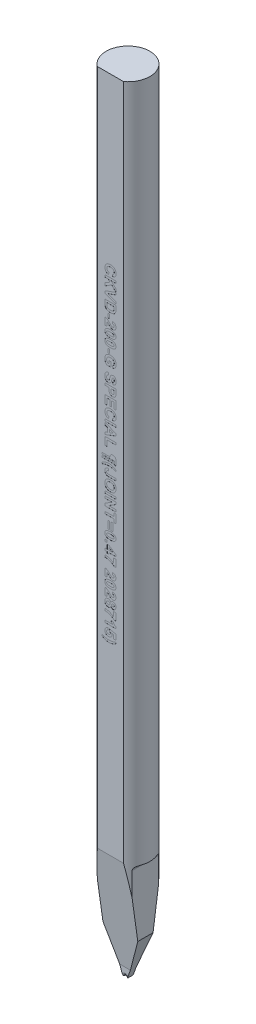
from build123d import *

# Parameters (mm, degrees)
SKETCH_TL_CUTTING_R       = 1.99771
TL_CUTTING_DEPTH          = 72.009
SKETCH_TDF_GRINDING_W     = 4.01542
SKETCH_TDF_GRINDING_H     = 4.01542
TDF_GRINDING_DEPTH        = 73.064400167
SKETCH_ENGRAVING_W        = 0.166666667
SKETCH_ENGRAVING_H        = 0.371794872
SKETCH_ENGRAVING_W_2      = 1
SKETCH_ENGRAVING_H_2      = 0.192307693
SKETCH_ENGRAVING_H_3      = 0.192307692
SKETCH_ENGRAVING_H_4      = 0.692307692
SKETCH_ENGRAVING_W_3      = 0.192307692
ENGRAVING_DEPTH           = 0.005
VW_VR_GRINDING_DEPTH      = 2.00771
VW_VR_GRINDING_DEPTH_BACK = 2.00771
ISA_GRINDING_DEPTH        = 2.00771
ISA_GRINDING_DEPTH_BACK   = 2.00771
PRE_FRX_BRX_DEPTH         = 2.00771
PRE_FRX_BRX_DEPTH_BACK    = 2.00771
SKETCH_PRE_FRX_BRX_W      = 1.7372
SKETCH_PRE_FRX_BRX_H      = 0.78994
FR_EDM_R                  = 0.20066
BR_EDM_R                  = 0.09906
FA_BA_GRINDING_DEPTH      = 2.00771
FA_BA_GRINDING_DEPTH_BACK = 2.00771


with BuildPart() as part:
    # sketch_TL_cutting → TL_cutting (new body)
    with BuildSketch(Plane(origin=(0, 0, 0), x_dir=(1, 0, 0), z_dir=(0, 1, 0))):
        Circle(SKETCH_TL_CUTTING_R)
    extrude(amount=TL_CUTTING_DEPTH)

    # sketch_TDF_grinding → TDF_grinding (cut, through all)
    with BuildSketch(Plane(origin=(0, 0, 0), x_dir=(1, 0, 0), z_dir=(0, 1, 0))):
        with Locations((0, -3.60918)):
            Rectangle(SKETCH_TDF_GRINDING_W, SKETCH_TDF_GRINDING_H)
    extrude(amount=TDF_GRINDING_DEPTH, mode=Mode.SUBTRACT)

    # sketch_engraving → engraving (cut)
    # profile 1 of 38: a face of its own
    with BuildSketch(Plane.XY.offset(1.60147)):
        with BuildLine():
            Line((-0.128205128, 56.265410256), (-0.192307692, 56.073102564))
            add(Edge.make_bspline(
                [(-0.192307692, 56.073102564), (-0.204917923, 56.077009052), (-0.229612721, 56.084659184), (-0.2649877, 56.098737804), (-0.297871332, 56.114732008), (-0.328259475, 56.132559875), (-0.356049464, 56.152295258), (-0.381471598, 56.173789244), (-0.404368127, 56.197253424), (-0.424673345, 56.222670624), (-0.442633936, 56.249763711), (-0.457816548, 56.278856053), (-0.470893242, 56.30951117), (-0.481488041, 56.342040557), (-0.489972889, 56.376228151), (-0.495577171, 56.412234413), (-0.499377062, 56.449890896), (-0.499789062, 56.475603283), (-0.5, 56.488767628)],
                knots=[0, 0, 0, 0, 1.126670901, 2.206376047, 3.246533763, 4.245677351, 5.210506282, 6.152793389, 7.083980095, 8.004497442, 8.926231833, 9.854395169, 10.801995143, 11.768203916, 12.771938831, 13.805609698, 14.87650608, 16, 16, 16, 16], degree=3))
            add(Edge.make_bspline(
                [(-0.5, 56.488767628), (-0.499663994, 56.505016309), (-0.499003061, 56.536977949), (-0.492350465, 56.583719052), (-0.481969511, 56.628260328), (-0.467601869, 56.670669613), (-0.448555271, 56.710648786), (-0.42571373, 56.748573108), (-0.398318662, 56.784009391), (-0.367249987, 56.817150716), (-0.332452821, 56.847279196), (-0.294134751, 56.873272297), (-0.253074131, 56.895810491), (-0.208709772, 56.913736594), (-0.161353037, 56.927821791), (-0.110975156, 56.937668328), (-0.057578507, 56.943834942), (-0.020984357, 56.944537083), (-0.002203526, 56.944897436)],
                knots=[0, 0, 0, 0, 1.025134988, 2.016471176, 2.973446247, 3.909197306, 4.836872559, 5.763618465, 6.698581235, 7.658772073, 8.627106982, 9.597494692, 10.576422683, 11.578339294, 12.6118974, 13.690673505, 14.814808564, 16, 16, 16, 16], degree=3))
            add(Edge.make_bspline(
                [(-0.002203526, 56.944897436), (0.017576475, 56.9445292), (0.056163648, 56.943810839), (0.112313555, 56.937762878), (0.165084042, 56.927716768), (0.214577853, 56.914140058), (0.260470573, 56.895929249), (0.303160692, 56.874073909), (0.342311169, 56.847956152), (0.377833814, 56.818031091), (0.409480853, 56.784897852), (0.437377469, 56.749193428), (0.460593243, 56.710691041), (0.479896446, 56.669867336), (0.494630503, 56.626423397), (0.505304611, 56.580476602), (0.511505561, 56.532006054), (0.512376199, 56.49886808), (0.512820513, 56.481956731)],
                knots=[0, 0, 0, 0, 1.212773307, 2.365899439, 3.458117515, 4.504331001, 5.50806732, 6.480562534, 7.440239902, 8.387651817, 9.323121479, 10.245404239, 11.160468186, 12.07454208, 13.009500751, 13.96802424, 14.963018902, 16, 16, 16, 16], degree=3))
            add(Edge.make_bspline(
                [(0.512820513, 56.481956731), (0.512448361, 56.467187276), (0.511718707, 56.438229796), (0.506761415, 56.395824506), (0.498061698, 56.355636158), (0.486319015, 56.317447521), (0.470821797, 56.281475987), (0.451884357, 56.247657111), (0.429606892, 56.215874651), (0.412205553, 56.196725065), (0.403445513, 56.187084936)],
                knots=[0, 0, 0, 0, 1.098510076, 2.153775193, 3.169777012, 4.153122333, 5.120892526, 6.076995459, 7.031936742, 8, 8, 8, 8], degree=3))
            add(Edge.make_bspline(
                [(0.403445513, 56.187084936), (0.39787141, 56.181497644), (0.386592274, 56.170191818), (0.367549896, 56.155095368), (0.347050772, 56.140782058), (0.324745215, 56.127479068), (0.30046466, 56.115606849), (0.274581981, 56.104594097), (0.246997406, 56.094455069), (0.227800247, 56.088816604), (0.217948718, 56.085923077)],
                knots=[0, 0, 0, 0, 0.885292881, 1.791380647, 2.722937556, 3.69093542, 4.703306561, 5.754477758, 6.847650944, 8, 8, 8, 8], degree=3))
            Line((0.217948718, 56.085923077), (0.179487179, 56.278230769))
            add(Edge.make_bspline(
                [(0.179487179, 56.278230769), (0.1857949, 56.279865288), (0.198219456, 56.283084861), (0.21607256, 56.28959955), (0.233014714, 56.297071208), (0.248625569, 56.3063361), (0.263619506, 56.316162074), (0.277222328, 56.327824773), (0.290109132, 56.340329754), (0.301694454, 56.354218861), (0.312145605, 56.369093589), (0.321339918, 56.384803983), (0.329014435, 56.401388478), (0.335156827, 56.418721754), (0.340319842, 56.436745702), (0.34350638, 56.455632147), (0.345953545, 56.475215752), (0.3460861, 56.488558875), (0.346153846, 56.495378205)],
                knots=[0, 0, 0, 0, 1.051114734, 2.070420253, 3.064047898, 4.034553068, 4.997066449, 5.953344811, 6.921213386, 7.892675544, 8.867420182, 9.852654213, 10.826683617, 11.811917648, 12.818610352, 13.848120519, 14.900229319, 16, 16, 16, 16], degree=3))
            add(Edge.make_bspline(
                [(0.346153846, 56.495378205), (0.345958725, 56.504742256), (0.345576529, 56.52308423), (0.341532101, 56.54981448), (0.335695112, 56.575255692), (0.326982094, 56.59931706), (0.315677399, 56.621931698), (0.302244603, 56.643428905), (0.286035184, 56.663260806), (0.26758257, 56.681899764), (0.246135655, 56.698607721), (0.221779967, 56.713310652), (0.194212535, 56.725504121), (0.163711493, 56.735404409), (0.130202077, 56.743196736), (0.093641969, 56.748761162), (0.054005962, 56.751838434), (0.026581025, 56.752333903), (0.012419872, 56.752589744)],
                knots=[0, 0, 0, 0, 0.93816214, 1.837638998, 2.704791736, 3.551915875, 4.396257554, 5.235807848, 6.087970119, 6.959042444, 7.860386085, 8.80649345, 9.804409709, 10.875695391, 12.017327537, 13.250155505, 14.580089023, 16, 16, 16, 16], degree=3))
            add(Edge.make_bspline(
                [(0.012419872, 56.752589744), (-0.002609028, 56.752336423), (-0.031567402, 56.751848312), (-0.073337178, 56.748771685), (-0.111754322, 56.743171705), (-0.14688701, 56.735482849), (-0.178713725, 56.725532973), (-0.207179389, 56.713359106), (-0.23231734, 56.698886701), (-0.254110839, 56.682138275), (-0.272831387, 56.663537256), (-0.288926796, 56.643587439), (-0.302688307, 56.622406524), (-0.314010391, 56.599867053), (-0.322575422, 56.575883298), (-0.328786932, 56.550652371), (-0.332735688, 56.524081695), (-0.333131326, 56.505875799), (-0.333333333, 56.496580128)],
                knots=[0, 0, 0, 0, 1.475208372, 2.842499301, 4.107722225, 5.282836115, 6.369007568, 7.375918121, 8.315702116, 9.208439171, 10.065831443, 10.90006451, 11.71996243, 12.54067204, 13.369972975, 14.214060185, 15.088124569, 16, 16, 16, 16], degree=3))
            add(Edge.make_bspline(
                [(-0.333333333, 56.496580128), (-0.333161634, 56.489697953), (-0.332824013, 56.476165176), (-0.330681155, 56.456162689), (-0.326591822, 56.43696438), (-0.321184418, 56.418476281), (-0.314399721, 56.400626559), (-0.305696319, 56.38368748), (-0.295693052, 56.367325777), (-0.283969989, 56.35188094), (-0.270808612, 56.337146156), (-0.255597341, 56.323707159), (-0.238701667, 56.311241373), (-0.220008678, 56.299906947), (-0.199678377, 56.28932516), (-0.177394008, 56.280322121), (-0.153515697, 56.271934984), (-0.136789345, 56.267623153), (-0.128205128, 56.265410256)],
                knots=[0, 0, 0, 0, 0.980177776, 1.927374078, 2.859849964, 3.771585772, 4.668674471, 5.574490016, 6.479656464, 7.396337719, 8.332153134, 9.288470092, 10.28125149, 11.318486971, 12.398724812, 13.541284404, 14.738150009, 16, 16, 16, 16], degree=3))
        make_face()
    # profile 2 of 38: a face of its own
    with BuildSketch(Plane.XY.offset(1.60147)):
        Polygon((-0.5, 55.906435897), (0.5, 55.906435897), (0.5, 55.714128205), (0.052283654, 55.714128205), (0.5, 55.292453526), (0.5, 55.028230769), (0.11338141, 55.408038462), (-0.5, 55.015410256), (-0.5, 55.271620192), (-0.035456731, 55.553871795), (-0.198517628, 55.714128205), (-0.5, 55.714128205), align=None)
    # profile 3 of 38: a face of its own
    with BuildSketch(Plane.XY.offset(1.60147)):
        Polygon((-0.5, 54.639208333), (0.5, 55.009), (0.5, 54.805875), (-0.243589744, 54.541051282), (0.5, 54.277229167), (0.5, 54.073102564), (-0.5, 54.441491987), align=None)
    # profile 4 of 38: a face of its own
    with BuildSketch(Plane.XY.offset(1.60147)):
        with BuildLine():
            Line((0.5, 53.983358974), (0.5, 53.616572115))
            add(Edge.make_bspline(
                [(0.5, 53.616572115), (0.500005193, 53.606554571), (0.500015306, 53.587048084), (0.498840892, 53.558739066), (0.497659587, 53.532266494), (0.495294873, 53.507706352), (0.492816233, 53.484973432), (0.489678088, 53.464026942), (0.485656212, 53.444999202), (0.482484481, 53.433000319), (0.480969551, 53.427269231)],
                knots=[0, 0, 0, 0, 1.259756885, 2.453039283, 3.563158368, 4.591894114, 5.55549294, 6.43918076, 7.254497783, 8, 8, 8, 8], degree=3))
            add(Edge.make_bspline(
                [(0.480969551, 53.427269231), (0.478637325, 53.420100254), (0.474014881, 53.405891431), (0.465827813, 53.385038378), (0.455960096, 53.365204479), (0.445111978, 53.345929819), (0.432903728, 53.327657553), (0.419595761, 53.309942873), (0.404753223, 53.293309803), (0.383633179, 53.27177514), (0.35420815, 53.247350255), (0.315375005, 53.22151972), (0.272594656, 53.199782014), (0.234409605, 53.184590641), (0.20183843, 53.174546542), (0.175754603, 53.167978141), (0.148301213, 53.162306468), (0.119383738, 53.158056292), (0.08913491, 53.154394906), (0.057465542, 53.151767238), (0.024383276, 53.15046625), (0.001870575, 53.150174494), (-0.009615385, 53.150025641)],
                knots=[0, 0, 0, 0, 0.745431882, 1.477436776, 2.212739876, 2.934276521, 3.663147754, 4.384200836, 5.123377481, 5.865761747, 7.365547505, 8.894711587, 10.468722596, 12.101948761, 12.951987285, 13.837595333, 14.760899389, 15.722756883, 16.726861385, 17.773652936, 18.864119771, 20, 20, 20, 20], degree=3))
            add(Edge.make_bspline(
                [(-0.009615385, 53.150025641), (-0.0294616, 53.150417046), (-0.067834928, 53.15117384), (-0.123301552, 53.156771211), (-0.17465514, 53.166066648), (-0.206804138, 53.175777075), (-0.222355769, 53.180474359)],
                knots=[0, 0, 0, 0, 1.103491527, 2.133638164, 3.0971734, 4, 4, 4, 4], degree=3))
            add(Edge.make_bspline(
                [(-0.222355769, 53.180474359), (-0.231274521, 53.183648003), (-0.248819098, 53.189891057), (-0.274127236, 53.200815932), (-0.298211673, 53.212620337), (-0.321053432, 53.225402184), (-0.342549771, 53.239226052), (-0.362636394, 53.254143645), (-0.381577746, 53.269923731), (-0.393236239, 53.28135549), (-0.399038462, 53.287044872)],
                knots=[0, 0, 0, 0, 1.090884612, 2.145940218, 3.175104604, 4.181306866, 5.161203701, 6.118658341, 7.063689906, 8, 8, 8, 8], degree=3))
            add(Edge.make_bspline(
                [(-0.399038462, 53.287044872), (-0.407300305, 53.296331145), (-0.424264154, 53.315398431), (-0.445652736, 53.34874995), (-0.464086504, 53.386625276), (-0.473760833, 53.413939168), (-0.478766026, 53.428070513)],
                knots=[0, 0, 0, 0, 0.912008655, 1.872605891, 2.89935344, 4, 4, 4, 4], degree=3))
            add(Edge.make_bspline(
                [(-0.478766026, 53.428070513), (-0.4805228, 53.433790486), (-0.484168894, 53.445661996), (-0.488062998, 53.464485444), (-0.492165475, 53.484579947), (-0.49463687, 53.506177223), (-0.497243066, 53.529053081), (-0.498706299, 53.553389822), (-0.49974511, 53.579103081), (-0.499913777, 53.596739175), (-0.5, 53.605754808)],
                knots=[0, 0, 0, 0, 0.799129865, 1.658552685, 2.566799617, 3.538529252, 4.561352959, 5.643373779, 6.795284424, 8, 8, 8, 8], degree=3))
            Line((-0.5, 53.605754808), (-0.5, 53.983358974))
            Line((-0.5, 53.983358974), (0.5, 53.983358974))
        make_face()
        with BuildLine():
            Line((0.333333333, 53.791051282), (-0.333333333, 53.791051282))
            Line((-0.333333333, 53.791051282), (-0.333333333, 53.632798077))
            add(Edge.make_bspline(
                [(-0.333333333, 53.632798077), (-0.333276671, 53.62565336), (-0.333167574, 53.611897049), (-0.332847006, 53.591991316), (-0.331979167, 53.573698115), (-0.331080228, 53.556921614), (-0.329595022, 53.54170549), (-0.328134266, 53.527983535), (-0.326090699, 53.515832132), (-0.324477534, 53.508327127), (-0.323717949, 53.504793269)],
                knots=[0, 0, 0, 0, 1.333384787, 2.567275092, 3.714769766, 4.750907381, 5.701951617, 6.567520054, 7.325492842, 8, 8, 8, 8], degree=3))
            add(Edge.make_bspline(
                [(-0.323717949, 53.504793269), (-0.321509316, 53.496516575), (-0.317207482, 53.480395757), (-0.307617456, 53.457760499), (-0.296048139, 53.437278507), (-0.282136533, 53.41860677), (-0.26455548, 53.40177967), (-0.242070693, 53.387415683), (-0.215254411, 53.374122192), (-0.189584523, 53.365018806), (-0.16665678, 53.358484413), (-0.147412959, 53.354061165), (-0.126593091, 53.350565591), (-0.104279343, 53.347558942), (-0.080500412, 53.345129499), (-0.055170426, 53.343617784), (-0.028320392, 53.342586029), (-0.009883527, 53.342419161), (-0.000400641, 53.342333333)],
                knots=[0, 0, 0, 0, 1.038686998, 2.023088296, 2.974059649, 3.888265163, 4.839857954, 5.909819677, 7.113156087, 8.466843969, 9.20827164, 10.006482943, 10.861893492, 11.769681931, 12.739021491, 13.762258324, 14.849031541, 16, 16, 16, 16], degree=3))
            add(Edge.make_bspline(
                [(-0.000400641, 53.342333333), (0.009082275, 53.3424185), (0.027452469, 53.342583485), (0.054102292, 53.343613664), (0.079033415, 53.345116863), (0.102276578, 53.347563691), (0.123864169, 53.350523456), (0.143813574, 53.354060891), (0.161996804, 53.358454423), (0.183589283, 53.365007511), (0.207947697, 53.374844996), (0.23429421, 53.388671199), (0.2571147, 53.404936402), (0.276689574, 53.423291558), (0.29287817, 53.444378569), (0.306422028, 53.467749371), (0.316938162, 53.493880279), (0.321416742, 53.512469318), (0.323717949, 53.522020833)],
                knots=[0, 0, 0, 0, 1.118059345, 2.165891593, 3.144157881, 4.062285166, 4.920717571, 5.712910489, 6.449981617, 7.12489426, 8.371943983, 9.541298068, 10.624898781, 11.666293176, 12.69306237, 13.747704633, 14.842713931, 16, 16, 16, 16], degree=3))
            add(Edge.make_bspline(
                [(0.323717949, 53.522020833), (0.324486218, 53.526155143), (0.326177652, 53.535257311), (0.328151987, 53.550361571), (0.329628909, 53.568148179), (0.331099472, 53.588577116), (0.331977905, 53.611627064), (0.332859431, 53.637332571), (0.333166326, 53.665716851), (0.333276065, 53.685549207), (0.333333333, 53.695899038)],
                knots=[0, 0, 0, 0, 0.578739524, 1.274162912, 2.095457587, 3.035141998, 4.093102578, 5.270121571, 6.575369351, 8, 8, 8, 8], degree=3))
            Line((0.333333333, 53.695899038), (0.333333333, 53.791051282))
        make_face(mode=Mode.SUBTRACT)
    # profile 5 of 38: a face of its own
    with BuildSketch(Plane.XY.offset(1.60147)):
        with Locations((-0.147435898, 52.823102564)):
            Rectangle(SKETCH_ENGRAVING_W, SKETCH_ENGRAVING_H)
    # profile 6 of 38: a face of its own
    with BuildSketch(Plane.XY.offset(1.60147)):
        with BuildLine():
            Line((-0.307692308, 51.91925641), (-0.5, 51.91925641))
            Line((-0.5, 51.91925641), (-0.5, 52.573102564))
            add(Edge.make_bspline(
                [(-0.5, 52.573102564), (-0.483565984, 52.5708845), (-0.450707166, 52.566449615), (-0.402658764, 52.552822822), (-0.355879438, 52.534298094), (-0.317848438, 52.514392572), (-0.286923212, 52.49503663), (-0.262057708, 52.476824911), (-0.235074392, 52.455795206), (-0.206603976, 52.431244574), (-0.176093602, 52.403785521), (-0.14381225, 52.373076523), (-0.109876761, 52.339020728), (-0.086834533, 52.315059651), (-0.074919872, 52.302669872)],
                knots=[0, 0, 0, 0, 1.156381417, 2.312114436, 3.475445649, 4.663832578, 5.302694182, 6.020660876, 6.814180865, 7.69035705, 8.644181007, 9.679458435, 10.800095821, 12, 12, 12, 12], degree=3))
            add(Edge.make_bspline(
                [(-0.074919872, 52.302669872), (-0.065377972, 52.292780973), (-0.047213006, 52.273955421), (-0.021173696, 52.247176806), (0.002635387, 52.223569628), (0.024062885, 52.202997359), (0.042867348, 52.185186177), (0.059484162, 52.170614894), (0.073602098, 52.158829106), (0.082565079, 52.152452026), (0.086538462, 52.149625)],
                knots=[0, 0, 0, 0, 1.480739016, 2.818890974, 4.024686436, 5.093297083, 6.019761393, 6.815071481, 7.474708909, 8, 8, 8, 8], degree=3))
            add(Edge.make_bspline(
                [(0.086538462, 52.149625), (0.096145343, 52.143806108), (0.114654059, 52.132595371), (0.143960972, 52.120736299), (0.173010268, 52.112996232), (0.192528875, 52.112036075), (0.202123397, 52.111564103)],
                knots=[0, 0, 0, 0, 1.091434863, 2.102769638, 3.067401785, 4, 4, 4, 4], degree=3))
            add(Edge.make_bspline(
                [(0.202123397, 52.111564103), (0.212103794, 52.111917564), (0.230985925, 52.112586284), (0.257559137, 52.118379288), (0.280564781, 52.128207351), (0.299731306, 52.142220562), (0.314878913, 52.159869559), (0.325894297, 52.18062659), (0.332110851, 52.204564417), (0.33291372, 52.22137036), (0.333333333, 52.230153846)],
                knots=[0, 0, 0, 0, 1.192552326, 2.256215989, 3.232470907, 4.163657734, 5.069678789, 5.991331675, 6.950186205, 8, 8, 8, 8], degree=3))
            add(Edge.make_bspline(
                [(0.333333333, 52.230153846), (0.332938162, 52.238876083), (0.332174776, 52.255725562), (0.325505939, 52.279672328), (0.313961482, 52.300621328), (0.30080546, 52.3155507), (0.288012183, 52.325636199), (0.276863686, 52.332508106), (0.264195574, 52.338431153), (0.250150469, 52.343679467), (0.23456747, 52.347825042), (0.217565257, 52.35116363), (0.199052334, 52.35385405), (0.186173423, 52.354709651), (0.179487179, 52.355153846)],
                knots=[0, 0, 0, 0, 1.402788338, 2.709884207, 3.961032948, 5.225417836, 5.883680772, 6.578928686, 7.329201998, 8.132101139, 8.990263233, 9.922304639, 10.921339128, 12, 12, 12, 12], degree=3))
            Line((0.179487179, 52.355153846), (0.198317308, 52.547461538))
            add(Edge.make_bspline(
                [(0.198317308, 52.547461538), (0.211300501, 52.545915414), (0.236472838, 52.542917727), (0.272628993, 52.535436947), (0.305984679, 52.525962817), (0.336477992, 52.514043673), (0.364302841, 52.500172147), (0.389041697, 52.483640677), (0.410968596, 52.465026889), (0.430071868, 52.444314696), (0.446412285, 52.421635774), (0.460998615, 52.397838314), (0.472964043, 52.372457248), (0.482825353, 52.345772022), (0.490706433, 52.317794696), (0.495917297, 52.288395871), (0.499582638, 52.257756985), (0.499858783, 52.236842754), (0.5, 52.226147436)],
                knots=[0, 0, 0, 0, 1.270971563, 2.464210789, 3.586263665, 4.638946707, 5.643716971, 6.603612468, 7.52484387, 8.434700188, 9.336036235, 10.239171475, 11.145359471, 12.059630629, 13.003312604, 13.96741569, 14.960557767, 16, 16, 16, 16], degree=3))
            add(Edge.make_bspline(
                [(0.5, 52.226147436), (0.499776553, 52.214520228), (0.499341362, 52.191874782), (0.495746905, 52.158816703), (0.489481026, 52.127760072), (0.48117587, 52.098437686), (0.470106061, 52.071135423), (0.456633778, 52.045631801), (0.440545401, 52.022185967), (0.422288069, 52.000772647), (0.402418882, 51.98155341), (0.380890105, 51.965099126), (0.358545244, 51.950653325), (0.334632005, 51.939313401), (0.309750235, 51.930074415), (0.283460918, 51.9241297), (0.256153456, 51.919782639), (0.237464899, 51.91943376), (0.227964744, 51.91925641)],
                knots=[0, 0, 0, 0, 1.21054264, 2.357683783, 3.456743179, 4.506371233, 5.526380269, 6.518616322, 7.504105716, 8.480749833, 9.444588379, 10.376395364, 11.298423092, 12.209585683, 13.126776925, 14.056012185, 15.011791738, 16, 16, 16, 16], degree=3))
            add(Edge.make_bspline(
                [(0.227964744, 51.91925641), (0.217064496, 51.919501523), (0.195440077, 51.919987788), (0.163469012, 51.924628232), (0.132249846, 51.931752879), (0.101610438, 51.942160599), (0.071147148, 51.955832869), (0.040108962, 51.972570405), (0.008522341, 51.99284347), (-0.012178306, 52.008269216), (-0.022836538, 52.016211538)],
                knots=[0, 0, 0, 0, 0.953498, 1.891593709, 2.82157134, 3.753035249, 4.718494268, 5.740911752, 6.836853288, 8, 8, 8, 8], degree=3))
            add(Edge.make_bspline(
                [(-0.022836538, 52.016211538), (-0.026670091, 52.019250283), (-0.034880672, 52.025758569), (-0.047378398, 52.036864169), (-0.061345658, 52.049468652), (-0.076193638, 52.064149991), (-0.092563957, 52.08036898), (-0.109838998, 52.098555378), (-0.128325502, 52.118525449), (-0.147648705, 52.139476619), (-0.166391428, 52.160637623), (-0.184247543, 52.179983916), (-0.20029985, 52.197316722), (-0.214732899, 52.212468686), (-0.227268639, 52.225705936), (-0.238167377, 52.236775957), (-0.247265417, 52.245857085), (-0.26144337, 52.258373362), (-0.280620183, 52.274297881), (-0.298943771, 52.285501724), (-0.307692308, 52.290850962)],
                knots=[0, 0, 0, 0, 0.665546509, 1.425446362, 2.274432636, 3.225431318, 4.2662943, 5.410247296, 6.638261485, 7.969509561, 9.288545809, 10.484715594, 11.551975365, 12.503234464, 13.332293902, 14.032657109, 14.617374704, 15.080693821, 16.606187002, 18, 18, 18, 18], degree=3))
            Line((-0.307692308, 52.290850962), (-0.307692308, 51.91925641))
        make_face()
    # profile 7 of 38: a face of its own
    with BuildSketch(Plane.XY.offset(1.60147)):
        with BuildLine():
            add(Edge.make_bspline(
                [(0.5, 51.476948718), (0.49971384, 51.465044998), (0.499156721, 51.441869821), (0.494192381, 51.408107508), (0.486315205, 51.376354925), (0.474936732, 51.346605943), (0.460535804, 51.318709267), (0.442472771, 51.293057415), (0.421624591, 51.26905643), (0.405435577, 51.255200797), (0.397235577, 51.248182692)],
                knots=[0, 0, 0, 0, 1.098626248, 2.138899374, 3.143835643, 4.113754749, 5.073488057, 6.034745239, 7.004566348, 8, 8, 8, 8], degree=3))
            add(Edge.make_bspline(
                [(0.397235577, 51.248182692), (0.392013767, 51.244167993), (0.381356969, 51.235974695), (0.364136726, 51.22494029), (0.345869985, 51.214331685), (0.326116385, 51.205073442), (0.305221356, 51.196200078), (0.283126793, 51.188009313), (0.259707844, 51.18077695), (0.235071142, 51.174472124), (0.209179241, 51.168578627), (0.181968999, 51.163641398), (0.15350924, 51.159415972), (0.123831018, 51.156120738), (0.092992495, 51.153166339), (0.060842825, 51.151549757), (0.027454838, 51.150225267), (0.004742429, 51.150092949), (-0.006810897, 51.150025641)],
                knots=[0, 0, 0, 0, 0.746775751, 1.524038446, 2.317840886, 3.141016509, 3.996283186, 4.892488336, 5.812382473, 6.774967264, 7.776368117, 8.823659909, 9.910833035, 11.039122168, 12.210293276, 13.424012874, 14.68964937, 16, 16, 16, 16], degree=3))
            add(Edge.make_bspline(
                [(-0.006810897, 51.150025641), (-0.01836425, 51.150091934), (-0.041009977, 51.150221876), (-0.074330982, 51.151554693), (-0.106413621, 51.153167781), (-0.13725379, 51.156113853), (-0.166926114, 51.159440728), (-0.195353975, 51.163546272), (-0.22243919, 51.168864764), (-0.248289812, 51.174671418), (-0.27303117, 51.180936077), (-0.296407841, 51.1884899), (-0.318777777, 51.196350303), (-0.339699687, 51.205429898), (-0.359477735, 51.215020372), (-0.377930928, 51.225471112), (-0.395257891, 51.236628726), (-0.40597091, 51.244901289), (-0.411258013, 51.248983974)],
                knots=[0, 0, 0, 0, 1.308411734, 2.564617834, 3.776541518, 4.94597967, 6.0725993, 7.15816376, 8.197872509, 9.197791611, 10.158952087, 11.086962723, 11.979249638, 12.843171697, 13.668427753, 14.467630577, 15.243743175, 16, 16, 16, 16], degree=3))
            add(Edge.make_bspline(
                [(-0.411258013, 51.248983974), (-0.419387722, 51.255937875), (-0.435436162, 51.269665209), (-0.456111536, 51.293400465), (-0.473801555, 51.3190109), (-0.487914093, 51.346857064), (-0.499368982, 51.376461236), (-0.506993451, 51.408265546), (-0.511967929, 51.441935616), (-0.512532265, 51.465111213), (-0.512820513, 51.476948718)],
                knots=[0, 0, 0, 0, 0.991667276, 1.957599061, 2.911530233, 3.873218945, 4.847995157, 5.850445929, 6.902062539, 8, 8, 8, 8], degree=3))
            add(Edge.make_bspline(
                [(-0.512820513, 51.476948718), (-0.512476011, 51.488921133), (-0.511800941, 51.512381702), (-0.506449472, 51.546635149), (-0.497876451, 51.579194622), (-0.485636462, 51.609943234), (-0.469774335, 51.638836989), (-0.45076002, 51.666101616), (-0.427732542, 51.691143948), (-0.40629523, 51.710749361), (-0.386925042, 51.725092741), (-0.37086259, 51.735209036), (-0.353675124, 51.744985358), (-0.33482528, 51.753423499), (-0.314870578, 51.761748475), (-0.293380967, 51.769121787), (-0.270541238, 51.775626959), (-0.246455682, 51.781734901), (-0.220958398, 51.786828025), (-0.194124629, 51.791512952), (-0.165840258, 51.795204927), (-0.136262825, 51.798478243), (-0.105322509, 51.800782844), (-0.073069943, 51.802654475), (-0.039401887, 51.803592969), (-0.01649349, 51.803777608), (-0.004807692, 51.803871795)],
                knots=[0, 0, 0, 0, 1.257818097, 2.464759732, 3.634271214, 4.790227596, 5.933394726, 7.09190477, 8.274482889, 9.50191983, 10.139172818, 10.805000628, 11.49619854, 12.215266328, 12.973768034, 13.768328009, 14.601232062, 15.469317089, 16.379095881, 17.333267023, 18.331755967, 19.376479622, 20.460535752, 21.592206075, 22.771760786, 24, 24, 24, 24], degree=3))
            add(Edge.make_bspline(
                [(-0.004807692, 51.803871795), (0.006678925, 51.803806), (0.02919122, 51.803677052), (0.062378132, 51.802334948), (0.094328674, 51.800741634), (0.12509981, 51.79776902), (0.154640959, 51.794469515), (0.183004063, 51.790356894), (0.209982531, 51.784938814), (0.235876189, 51.779589743), (0.260431507, 51.772849782), (0.2837906, 51.765424475), (0.306110518, 51.757590136), (0.326924245, 51.748417854), (0.346659803, 51.738882898), (0.365109758, 51.728424838), (0.382437536, 51.717269066), (0.39315045, 51.708996265), (0.3984375, 51.704913462)],
                knots=[0, 0, 0, 0, 1.304443357, 2.556541329, 3.771813033, 4.936929721, 6.066661712, 7.147723817, 8.190304831, 9.191350322, 10.149780912, 11.080355239, 11.975107155, 12.834450748, 13.66198663, 14.463397305, 15.241653965, 16, 16, 16, 16], degree=3))
            add(Edge.make_bspline(
                [(0.3984375, 51.704913462), (0.406566428, 51.697959179), (0.422613323, 51.684231089), (0.443299998, 51.660501361), (0.460913987, 51.634919209), (0.475197493, 51.607154301), (0.486497465, 51.577482107), (0.494183265, 51.545636121), (0.499144648, 51.511960686), (0.499710816, 51.488785839), (0.5, 51.476948718)],
                knots=[0, 0, 0, 0, 0.991631672, 1.957528776, 2.911425699, 3.867574088, 4.848108326, 5.850523106, 6.902101959, 8, 8, 8, 8], degree=3))
        make_face()
        with BuildLine():
            add(Edge.make_bspline(
                [(0.333333333, 51.476948718), (0.333068079, 51.483116684), (0.332548986, 51.495187158), (0.328316127, 51.512742094), (0.321759633, 51.529323165), (0.312130705, 51.544881206), (0.299093083, 51.55928978), (0.281476094, 51.571497658), (0.259881539, 51.582051162), (0.243736, 51.587330771), (0.235176282, 51.590129808)],
                knots=[0, 0, 0, 0, 0.909107913, 1.77908945, 2.650019014, 3.530482969, 4.465025013, 5.495890128, 6.672421267, 8, 8, 8, 8], degree=3))
            add(Edge.make_bspline(
                [(0.235176282, 51.590129808), (0.228718042, 51.591877997), (0.214837576, 51.595635317), (0.192206647, 51.59989972), (0.166522939, 51.603416485), (0.137792419, 51.606386038), (0.105999886, 51.608802628), (0.071125109, 51.610290848), (0.033192525, 51.611319478), (0.006878451, 51.611480391), (-0.006810897, 51.611564103)],
                knots=[0, 0, 0, 0, 0.658986521, 1.416336438, 2.266694271, 3.212608458, 4.261595115, 5.407496572, 6.651304179, 8, 8, 8, 8], degree=3))
            add(Edge.make_bspline(
                [(-0.006810897, 51.611564103), (-0.020433943, 51.611573117), (-0.046549094, 51.611590397), (-0.084006477, 51.610416163), (-0.118154033, 51.60924872), (-0.148991056, 51.606879061), (-0.176626244, 51.604540892), (-0.200847568, 51.601003343), (-0.221857789, 51.597450608), (-0.244486895, 51.591417153), (-0.268257705, 51.583101394), (-0.292448985, 51.571872977), (-0.311537375, 51.559207058), (-0.325415776, 51.544675587), (-0.334597404, 51.528930329), (-0.341538269, 51.512626395), (-0.345246665, 51.495074555), (-0.345848983, 51.483040013), (-0.346153846, 51.476948718)],
                knots=[0, 0, 0, 0, 1.613038927, 3.092168624, 4.43749063, 5.658264602, 6.75425577, 7.720394221, 8.556328411, 9.275513998, 10.490872946, 11.534172084, 12.42681833, 13.187531851, 13.88996177, 14.574222125, 15.278341114, 16, 16, 16, 16], degree=3))
            add(Edge.make_bspline(
                [(-0.346153846, 51.476948718), (-0.345874419, 51.47085088), (-0.345321688, 51.458788799), (-0.341225408, 51.441256833), (-0.334465655, 51.424699336), (-0.325029126, 51.409036493), (-0.311901617, 51.39461441), (-0.294300445, 51.382397614), (-0.272700888, 51.37184693), (-0.25655611, 51.366566893), (-0.247996795, 51.363767628)],
                knots=[0, 0, 0, 0, 0.899391665, 1.779078861, 2.640979247, 3.529945348, 4.464599804, 5.495588918, 6.672261578, 8, 8, 8, 8], degree=3))
            add(Edge.make_bspline(
                [(-0.247996795, 51.363767628), (-0.241538043, 51.362021968), (-0.227719754, 51.358287186), (-0.205229709, 51.353992396), (-0.179679092, 51.35046611), (-0.151079269, 51.347524791), (-0.11935541, 51.345084431), (-0.084546407, 51.343608845), (-0.046680798, 51.342579247), (-0.020433482, 51.342417356), (-0.006810897, 51.342333333)],
                knots=[0, 0, 0, 0, 0.66114423, 1.414496391, 2.261103113, 3.210114492, 4.255954433, 5.405607896, 6.653488082, 8, 8, 8, 8], degree=3))
            add(Edge.make_bspline(
                [(-0.006810897, 51.342333333), (0.006810741, 51.342447109), (0.032921137, 51.342665199), (0.070464093, 51.343292091), (0.104645163, 51.345047006), (0.13553417, 51.346803226), (0.163028833, 51.349768631), (0.187277888, 51.352711537), (0.208178651, 51.356783667), (0.23096624, 51.362375697), (0.254848985, 51.37071368), (0.278913284, 51.38228584), (0.298191428, 51.39472291), (0.312146257, 51.409229879), (0.321683592, 51.424948044), (0.328364426, 51.441400374), (0.332523972, 51.458849531), (0.333060584, 51.47084941), (0.333333333, 51.476948718)],
                knots=[0, 0, 0, 0, 1.611458614, 3.088895909, 4.441089836, 5.660086535, 6.747875232, 7.711965119, 8.548505902, 9.26500436, 10.486583113, 11.532259092, 12.419544583, 13.184925779, 13.890764661, 14.581638641, 15.279074115, 16, 16, 16, 16], degree=3))
        make_face(mode=Mode.SUBTRACT)
    # profile 8 of 38: a face of its own
    with BuildSketch(Plane.XY.offset(1.60147)):
        with BuildLine():
            add(Edge.make_bspline(
                [(0.5, 50.707717949), (0.49971384, 50.695814229), (0.499156721, 50.672639051), (0.494192381, 50.638876739), (0.486315205, 50.607124156), (0.474936732, 50.577375173), (0.460535804, 50.549478497), (0.442472771, 50.523826646), (0.421624591, 50.499825661), (0.405435577, 50.485970028), (0.397235577, 50.478951923)],
                knots=[0, 0, 0, 0, 1.098626248, 2.138899374, 3.143835643, 4.113754749, 5.073488057, 6.034745239, 7.004566348, 8, 8, 8, 8], degree=3))
            add(Edge.make_bspline(
                [(0.397235577, 50.478951923), (0.392013767, 50.474937224), (0.381356969, 50.466743926), (0.364136726, 50.45570952), (0.345869985, 50.445100915), (0.326116385, 50.435842673), (0.305221356, 50.426969309), (0.283126793, 50.418778544), (0.259707844, 50.41154618), (0.235071142, 50.405241354), (0.209179241, 50.399347858), (0.181968999, 50.394410628), (0.15350924, 50.390185203), (0.123831018, 50.386889969), (0.092992495, 50.38393557), (0.060842825, 50.382318988), (0.027454838, 50.380994498), (0.004742429, 50.380862179), (-0.006810897, 50.380794872)],
                knots=[0, 0, 0, 0, 0.746775751, 1.524038446, 2.317840886, 3.141016509, 3.996283186, 4.892488336, 5.812382473, 6.774967264, 7.776368117, 8.823659909, 9.910833035, 11.039122168, 12.210293276, 13.424012874, 14.68964937, 16, 16, 16, 16], degree=3))
            add(Edge.make_bspline(
                [(-0.006810897, 50.380794872), (-0.01836425, 50.380861165), (-0.041009977, 50.380991107), (-0.074330982, 50.382323924), (-0.106413621, 50.383937012), (-0.13725379, 50.386883084), (-0.166926114, 50.390209959), (-0.195353975, 50.394315503), (-0.22243919, 50.399633995), (-0.248289812, 50.405440649), (-0.27303117, 50.411705308), (-0.296407841, 50.419259131), (-0.318777777, 50.427119533), (-0.339699687, 50.436199129), (-0.359477735, 50.445789602), (-0.377930928, 50.456240342), (-0.395257891, 50.467397957), (-0.40597091, 50.47567052), (-0.411258013, 50.479753205)],
                knots=[0, 0, 0, 0, 1.308411734, 2.564617834, 3.776541518, 4.94597967, 6.0725993, 7.15816376, 8.197872509, 9.197791611, 10.158952087, 11.086962723, 11.979249638, 12.843171697, 13.668427753, 14.467630577, 15.243743175, 16, 16, 16, 16], degree=3))
            add(Edge.make_bspline(
                [(-0.411258013, 50.479753205), (-0.419387722, 50.486707105), (-0.435436162, 50.50043444), (-0.456111536, 50.524169695), (-0.473801555, 50.549780131), (-0.487914093, 50.577626295), (-0.499368982, 50.607230467), (-0.506993451, 50.639034777), (-0.511967929, 50.672704847), (-0.512532265, 50.695880444), (-0.512820513, 50.707717949)],
                knots=[0, 0, 0, 0, 0.991667276, 1.957599061, 2.911530233, 3.873218945, 4.847995157, 5.850445929, 6.902062539, 8, 8, 8, 8], degree=3))
            add(Edge.make_bspline(
                [(-0.512820513, 50.707717949), (-0.512476011, 50.719690364), (-0.511800941, 50.743150933), (-0.506449472, 50.777404379), (-0.497876451, 50.809963853), (-0.485636462, 50.840712465), (-0.469774335, 50.86960622), (-0.45076002, 50.896870847), (-0.427732542, 50.921913179), (-0.40629523, 50.941518592), (-0.386925042, 50.955861971), (-0.37086259, 50.965978267), (-0.353675124, 50.975754589), (-0.33482528, 50.98419273), (-0.314870578, 50.992517706), (-0.293380967, 50.999891018), (-0.270541238, 51.00639619), (-0.246455682, 51.012504132), (-0.220958398, 51.017597256), (-0.194124629, 51.022282183), (-0.165840258, 51.025974157), (-0.136262825, 51.029247473), (-0.105322509, 51.031552075), (-0.073069943, 51.033423706), (-0.039401887, 51.0343622), (-0.01649349, 51.034546839), (-0.004807692, 51.034641026)],
                knots=[0, 0, 0, 0, 1.257818097, 2.464759732, 3.634271214, 4.790227596, 5.933394726, 7.09190477, 8.274482889, 9.50191983, 10.139172818, 10.805000628, 11.49619854, 12.215266328, 12.973768034, 13.768328009, 14.601232062, 15.469317089, 16.379095881, 17.333267023, 18.331755967, 19.376479622, 20.460535752, 21.592206075, 22.771760786, 24, 24, 24, 24], degree=3))
            add(Edge.make_bspline(
                [(-0.004807692, 51.034641026), (0.006678925, 51.034575231), (0.02919122, 51.034446282), (0.062378132, 51.033104179), (0.094328674, 51.031510865), (0.12509981, 51.028538251), (0.154640959, 51.025238746), (0.183004063, 51.021126125), (0.209982531, 51.015708045), (0.235876189, 51.010358974), (0.260431507, 51.003619013), (0.2837906, 50.996193706), (0.306110518, 50.988359367), (0.326924245, 50.979187084), (0.346659803, 50.969652128), (0.365109758, 50.959194069), (0.382437536, 50.948038297), (0.39315045, 50.939765495), (0.3984375, 50.935682692)],
                knots=[0, 0, 0, 0, 1.304443357, 2.556541329, 3.771813033, 4.936929721, 6.066661712, 7.147723817, 8.190304831, 9.191350322, 10.149780912, 11.080355239, 11.975107155, 12.834450748, 13.66198663, 14.463397305, 15.241653965, 16, 16, 16, 16], degree=3))
            add(Edge.make_bspline(
                [(0.3984375, 50.935682692), (0.406566428, 50.92872841), (0.422613323, 50.91500032), (0.443299998, 50.891270592), (0.460913987, 50.865688439), (0.475197493, 50.837923532), (0.486497465, 50.808251338), (0.494183265, 50.776405352), (0.499144648, 50.742729916), (0.499710816, 50.71955507), (0.5, 50.707717949)],
                knots=[0, 0, 0, 0, 0.991631672, 1.957528776, 2.911425699, 3.867574088, 4.848108326, 5.850523106, 6.902101959, 8, 8, 8, 8], degree=3))
        make_face()
        with BuildLine():
            add(Edge.make_bspline(
                [(0.333333333, 50.707717949), (0.333068079, 50.713885915), (0.332548986, 50.725956389), (0.328316127, 50.743511325), (0.321759633, 50.760092396), (0.312130705, 50.775650436), (0.299093083, 50.790059011), (0.281476094, 50.802266888), (0.259881539, 50.812820392), (0.243736, 50.818100001), (0.235176282, 50.820899038)],
                knots=[0, 0, 0, 0, 0.909107913, 1.77908945, 2.650019014, 3.530482969, 4.465025013, 5.495890128, 6.672421267, 8, 8, 8, 8], degree=3))
            add(Edge.make_bspline(
                [(0.235176282, 50.820899038), (0.228718042, 50.822647227), (0.214837576, 50.826404548), (0.192206647, 50.830668951), (0.166522939, 50.834185716), (0.137792419, 50.837155269), (0.105999886, 50.839571859), (0.071125109, 50.841060078), (0.033192525, 50.842088709), (0.006878451, 50.842249622), (-0.006810897, 50.842333333)],
                knots=[0, 0, 0, 0, 0.658986521, 1.416336438, 2.266694271, 3.212608458, 4.261595115, 5.407496572, 6.651304179, 8, 8, 8, 8], degree=3))
            add(Edge.make_bspline(
                [(-0.006810897, 50.842333333), (-0.020433943, 50.842342347), (-0.046549094, 50.842359627), (-0.084006477, 50.841185394), (-0.118154033, 50.840017951), (-0.148991056, 50.837648292), (-0.176626244, 50.835310123), (-0.200847568, 50.831772574), (-0.221857789, 50.828219839), (-0.244486895, 50.822186384), (-0.268257705, 50.813870625), (-0.292448985, 50.802642207), (-0.311537375, 50.789976289), (-0.325415776, 50.775444818), (-0.334597404, 50.75969956), (-0.341538269, 50.743395625), (-0.345246665, 50.725843786), (-0.345848983, 50.713809244), (-0.346153846, 50.707717949)],
                knots=[0, 0, 0, 0, 1.613038927, 3.092168624, 4.43749063, 5.658264602, 6.75425577, 7.720394221, 8.556328411, 9.275513998, 10.490872946, 11.534172084, 12.42681833, 13.187531851, 13.88996177, 14.574222125, 15.278341114, 16, 16, 16, 16], degree=3))
            add(Edge.make_bspline(
                [(-0.346153846, 50.707717949), (-0.345874419, 50.701620111), (-0.345321688, 50.68955803), (-0.341225408, 50.672026063), (-0.334465655, 50.655468567), (-0.325029126, 50.639805723), (-0.311901617, 50.625383641), (-0.294300445, 50.613166845), (-0.272700888, 50.602616161), (-0.25655611, 50.597336123), (-0.247996795, 50.594536859)],
                knots=[0, 0, 0, 0, 0.899391665, 1.779078861, 2.640979247, 3.529945348, 4.464599804, 5.495588918, 6.672261578, 8, 8, 8, 8], degree=3))
            add(Edge.make_bspline(
                [(-0.247996795, 50.594536859), (-0.241538043, 50.592791199), (-0.227719754, 50.589056417), (-0.205229709, 50.584761627), (-0.179679092, 50.58123534), (-0.151079269, 50.578294022), (-0.11935541, 50.575853662), (-0.084546407, 50.574378076), (-0.046680798, 50.573348478), (-0.020433482, 50.573186587), (-0.006810897, 50.573102564)],
                knots=[0, 0, 0, 0, 0.66114423, 1.414496391, 2.261103113, 3.210114492, 4.255954433, 5.405607896, 6.653488082, 8, 8, 8, 8], degree=3))
            add(Edge.make_bspline(
                [(-0.006810897, 50.573102564), (0.006810741, 50.57321634), (0.032921137, 50.57343443), (0.070464093, 50.574061322), (0.104645163, 50.575816237), (0.13553417, 50.577572457), (0.163028833, 50.580537861), (0.187277888, 50.583480768), (0.208178651, 50.587552897), (0.23096624, 50.593144928), (0.254848985, 50.60148291), (0.278913284, 50.613055071), (0.298191428, 50.625492141), (0.312146257, 50.63999911), (0.321683592, 50.655717274), (0.328364426, 50.672169605), (0.332523972, 50.689618762), (0.333060584, 50.701618641), (0.333333333, 50.707717949)],
                knots=[0, 0, 0, 0, 1.611458614, 3.088895909, 4.441089836, 5.660086535, 6.747875232, 7.711965119, 8.548505902, 9.26500436, 10.486583113, 11.532259092, 12.419544583, 13.184925779, 13.890764661, 14.581638641, 15.279074115, 16, 16, 16, 16], degree=3))
        make_face(mode=Mode.SUBTRACT)
    # profile 9 of 38: a face of its own
    with BuildSketch(Plane.XY.offset(1.60147)):
        with Locations((-0.147435898, 50.053871795)):
            Rectangle(SKETCH_ENGRAVING_W, SKETCH_ENGRAVING_H)
    # profile 10 of 38: a face of its own
    with BuildSketch(Plane.XY.offset(1.60147)):
        with BuildLine():
            Line((-0.128205128, 49.303871795), (0.038461538, 49.303871795))
            Line((0.038461538, 49.303871795), (0.038461538, 48.867974359))
            Line((0.038461538, 48.867974359), (-0.36338141, 48.867974359))
            add(Edge.make_bspline(
                [(-0.36338141, 48.867974359), (-0.368321434, 48.873460375), (-0.378419843, 48.8846749), (-0.392661125, 48.902972664), (-0.406257259, 48.923116779), (-0.4194836, 48.944985469), (-0.432233696, 48.968623992), (-0.444685123, 48.993938064), (-0.45671611, 49.020974391), (-0.471787381, 49.059207711), (-0.488186169, 49.10842183), (-0.502445448, 49.168587076), (-0.511191227, 49.229228267), (-0.512277771, 49.269789075), (-0.512820513, 49.290049679)],
                knots=[0, 0, 0, 0, 0.581799769, 1.189316438, 1.825828404, 2.496525428, 3.203088405, 3.942228803, 4.719818701, 5.534979611, 7.181138583, 8.803804008, 10.403462225, 12, 12, 12, 12], degree=3))
            add(Edge.make_bspline(
                [(-0.512820513, 49.290049679), (-0.512629241, 49.302742166), (-0.512252188, 49.327762831), (-0.509233571, 49.364701118), (-0.504017902, 49.400418224), (-0.496780719, 49.434850736), (-0.487836372, 49.468101646), (-0.476607913, 49.500054166), (-0.463065488, 49.530674068), (-0.447986133, 49.560190581), (-0.430657849, 49.588043177), (-0.411724289, 49.614287023), (-0.390891397, 49.638667404), (-0.36853351, 49.661396217), (-0.344060025, 49.682044803), (-0.318106216, 49.701126641), (-0.290219674, 49.718185038), (-0.260879177, 49.733511559), (-0.230317098, 49.747140942), (-0.198781008, 49.758643246), (-0.166726875, 49.768726922), (-0.134042675, 49.777014707), (-0.10062201, 49.783101654), (-0.066619552, 49.787833529), (-0.031822841, 49.790375004), (-0.008417054, 49.790824325), (0.003405449, 49.791051282)],
                knots=[0, 0, 0, 0, 1.124897971, 2.217508473, 3.282174662, 4.322209414, 5.334422951, 6.332119154, 7.320662553, 8.300074908, 9.267468154, 10.225199689, 11.165658754, 12.107290334, 13.047749399, 14.00069605, 14.959944213, 15.942088746, 16.933021067, 17.923599838, 18.915715637, 19.910475908, 20.909926025, 21.925232038, 22.952013513, 24, 24, 24, 24], degree=3))
            add(Edge.make_bspline(
                [(0.003405449, 49.791051282), (0.016165747, 49.790867383), (0.041321811, 49.790504838), (0.078501182, 49.787375194), (0.114594914, 49.782527239), (0.149519517, 49.775132247), (0.183523729, 49.766278796), (0.216299841, 49.754934109), (0.248180515, 49.741980661), (0.278688999, 49.726696543), (0.308028284, 49.709813971), (0.335510174, 49.6906304), (0.361403632, 49.6698108), (0.385591047, 49.647167968), (0.407627145, 49.622329007), (0.428063784, 49.595803308), (0.447146094, 49.56760846), (0.457908016, 49.547431736), (0.463341346, 49.537245192)],
                knots=[0, 0, 0, 0, 1.105132952, 2.178694671, 3.229818344, 4.257558797, 5.269123684, 6.27148554, 7.259679084, 8.247804916, 9.224967877, 10.189258471, 11.147685264, 12.101072275, 13.055511435, 14.02039165, 15.000562851, 16, 16, 16, 16], degree=3))
            add(Edge.make_bspline(
                [(0.463341346, 49.537245192), (0.467347168, 49.529157841), (0.475455657, 49.512787618), (0.485329628, 49.486714525), (0.494054347, 49.459346948), (0.500719187, 49.430365473), (0.506115234, 49.400078993), (0.510216979, 49.368337917), (0.512307439, 49.335083708), (0.512647258, 49.312421284), (0.512820513, 49.300866987)],
                knots=[0, 0, 0, 0, 0.887950456, 1.797368171, 2.741221183, 3.713797788, 4.722103116, 5.768966405, 6.862521341, 8, 8, 8, 8], degree=3))
            add(Edge.make_bspline(
                [(0.512820513, 49.300866987), (0.512598613, 49.285969487), (0.512167059, 49.256996604), (0.508571106, 49.21475631), (0.502373597, 49.175002674), (0.493837942, 49.137680334), (0.482863355, 49.102869697), (0.469371425, 49.070630687), (0.453633675, 49.040765429), (0.435019378, 49.013706485), (0.414494937, 48.988903918), (0.392035387, 48.966422449), (0.367607461, 48.946253031), (0.341334074, 48.928382318), (0.313106625, 48.912950967), (0.283182558, 48.899682952), (0.251334696, 48.888761769), (0.22921692, 48.883483803), (0.217948718, 48.880794872)],
                knots=[0, 0, 0, 0, 1.271135529, 2.472123572, 3.614091059, 4.701890498, 5.736279567, 6.724681829, 7.680621489, 8.611506429, 9.52200816, 10.424540711, 11.318996785, 12.221421405, 13.131851814, 14.060431888, 15.011860567, 16, 16, 16, 16], degree=3))
            Line((0.217948718, 48.880794872), (0.179487179, 49.073102564))
            add(Edge.make_bspline(
                [(0.179487179, 49.073102564), (0.185798707, 49.075005146), (0.198251232, 49.078758905), (0.216108293, 49.086065481), (0.232994438, 49.094383603), (0.248643132, 49.104210597), (0.263649233, 49.114648251), (0.277161531, 49.126918435), (0.290187329, 49.139825453), (0.301701762, 49.154316609), (0.312086782, 49.169755164), (0.321450083, 49.185976632), (0.329043783, 49.203344974), (0.335153652, 49.221617597), (0.340342569, 49.240705002), (0.343533767, 49.26085634), (0.345940549, 49.2818453), (0.346081986, 49.296185325), (0.346153846, 49.303471154)],
                knots=[0, 0, 0, 0, 1.027780279, 2.027791312, 3.006028774, 3.96000864, 4.908113241, 5.852721087, 6.802883308, 7.765918715, 8.733730415, 9.704005314, 10.683351261, 11.68471758, 12.707948499, 13.764514378, 14.864202456, 16, 16, 16, 16], degree=3))
            add(Edge.make_bspline(
                [(0.346153846, 49.303471154), (0.345859633, 49.314498511), (0.34528545, 49.336019337), (0.341538784, 49.367436876), (0.334873123, 49.397076442), (0.325679114, 49.42501554), (0.313877959, 49.451305391), (0.299029501, 49.475590737), (0.282012344, 49.49847627), (0.262039987, 49.519310747), (0.239645267, 49.53820525), (0.214561065, 49.554561822), (0.186868462, 49.568178599), (0.156706511, 49.579331515), (0.124073954, 49.588211616), (0.088855272, 49.594235764), (0.051104495, 49.598171833), (0.02505068, 49.598549093), (0.01161859, 49.59874359)],
                knots=[0, 0, 0, 0, 1.043810997, 2.037086103, 2.989314757, 3.91471467, 4.817033861, 5.710208705, 6.603920097, 7.511448416, 8.435617211, 9.371747005, 10.338444094, 11.350425613, 12.411431869, 13.5347293, 14.729025275, 16, 16, 16, 16], degree=3))
            add(Edge.make_bspline(
                [(0.01161859, 49.59874359), (-0.002813331, 49.598540916), (-0.03086261, 49.598147007), (-0.071503034, 49.594312106), (-0.109371212, 49.588013885), (-0.14440027, 49.578946527), (-0.176807311, 49.567639264), (-0.206438048, 49.553659735), (-0.233109204, 49.536851899), (-0.256980675, 49.517789064), (-0.278169336, 49.496752253), (-0.296147735, 49.473689293), (-0.31184176, 49.449431086), (-0.32420794, 49.423291286), (-0.33413508, 49.395742798), (-0.341078682, 49.366516769), (-0.345395871, 49.335718498), (-0.345897627, 49.314636945), (-0.346153846, 49.303871795)],
                knots=[0, 0, 0, 0, 1.31821493, 2.562027667, 3.72541598, 4.821825939, 5.863743127, 6.857000185, 7.808227391, 8.737146514, 9.643023621, 10.529087527, 11.404035307, 12.277173472, 13.164790074, 14.074766194, 15.016892606, 16, 16, 16, 16], degree=3))
            add(Edge.make_bspline(
                [(-0.346153846, 49.303871795), (-0.345850315, 49.292968504), (-0.34524035, 49.271057617), (-0.340086045, 49.238236537), (-0.332449955, 49.205236283), (-0.321065283, 49.172843933), (-0.307937779, 49.141457225), (-0.292687307, 49.112291024), (-0.276962331, 49.084898447), (-0.264654274, 49.068385969), (-0.258613782, 49.060282051)],
                knots=[0, 0, 0, 0, 0.993779204, 1.997065276, 3.023588959, 4.078879359, 5.123947549, 6.123456565, 7.079038607, 8, 8, 8, 8], degree=3))
            Line((-0.258613782, 49.060282051), (-0.128205128, 49.060282051))
            Line((-0.128205128, 49.060282051), (-0.128205128, 49.303871795))
        make_face()
    # profile 11 of 38: a face of its own
    with BuildSketch(Plane.XY.offset(1.60147)):
        with BuildLine():
            Line((-0.166666667, 48.342333333), (-0.153846154, 48.150025641))
            add(Edge.make_bspline(
                [(-0.153846154, 48.150025641), (-0.161891279, 48.148492992), (-0.177518424, 48.145515918), (-0.199795017, 48.138912009), (-0.220541784, 48.131605841), (-0.239662803, 48.122992964), (-0.25710555, 48.113127896), (-0.273156714, 48.102337618), (-0.28732832, 48.090094862), (-0.299925293, 48.076763176), (-0.310783278, 48.062189999), (-0.320246275, 48.046489399), (-0.328256178, 48.029568131), (-0.334922245, 48.011490819), (-0.339885492, 47.992077406), (-0.343420115, 47.971509762), (-0.345682646, 47.949754761), (-0.345994208, 47.934887096), (-0.346153846, 47.927269231)],
                knots=[0, 0, 0, 0, 1.20477517, 2.340199137, 3.415898527, 4.440826703, 5.422227366, 6.362763262, 7.28278988, 8.172822029, 9.057410505, 9.952475558, 10.866920142, 11.809098, 12.784128911, 13.811833846, 14.878831738, 16, 16, 16, 16], degree=3))
            add(Edge.make_bspline(
                [(-0.346153846, 47.927269231), (-0.346066367, 47.919250933), (-0.345896216, 47.903654929), (-0.343785338, 47.881054596), (-0.340761278, 47.859922259), (-0.335974263, 47.840444522), (-0.330620744, 47.822257658), (-0.323296559, 47.805813353), (-0.314849171, 47.790845499), (-0.305263574, 47.777392657), (-0.294632459, 47.765652348), (-0.28353392, 47.755381341), (-0.272207737, 47.746435972), (-0.260151301, 47.739395334), (-0.247852227, 47.733697439), (-0.234943611, 47.72993153), (-0.221721863, 47.727387435), (-0.212685699, 47.727095702), (-0.208133013, 47.726948718)],
                knots=[0, 0, 0, 0, 1.417779877, 2.757654889, 4.012140507, 5.189587551, 6.302846416, 7.360586765, 8.365575446, 9.33904572, 10.275781718, 11.161696098, 12.012180333, 12.822428111, 13.625933072, 14.403138519, 15.195454004, 16, 16, 16, 16], degree=3))
            add(Edge.make_bspline(
                [(-0.208133013, 47.726948718), (-0.202439146, 47.727242996), (-0.191320796, 47.727817629), (-0.175220679, 47.731587928), (-0.160658688, 47.738392431), (-0.147071392, 47.747628971), (-0.134926522, 47.760593369), (-0.123459543, 47.776997524), (-0.11316916, 47.797457237), (-0.107424402, 47.812625842), (-0.104366987, 47.820698718)],
                knots=[0, 0, 0, 0, 0.906150226, 1.7694295, 2.610923838, 3.450874087, 4.367551936, 5.419872502, 6.626831617, 8, 8, 8, 8], degree=3))
            add(Edge.make_bspline(
                [(-0.104366987, 47.820698718), (-0.103205903, 47.824162905), (-0.100607587, 47.831915194), (-0.096897182, 47.845141154), (-0.092218385, 47.861126556), (-0.087052561, 47.880019979), (-0.081545375, 47.901782885), (-0.074955523, 47.926208532), (-0.068334023, 47.953667832), (-0.063456004, 47.972880895), (-0.060897436, 47.982958333)],
                knots=[0, 0, 0, 0, 0.521824192, 1.167757792, 1.961731518, 2.901193269, 3.965386864, 5.168422915, 6.514810244, 8, 8, 8, 8], degree=3))
            add(Edge.make_bspline(
                [(-0.060897436, 47.982958333), (-0.0576208, 47.996081849), (-0.051299067, 48.021401528), (-0.040053153, 48.057513187), (-0.028879714, 48.090772685), (-0.016755933, 48.120859788), (-0.004503472, 48.148106368), (0.008737874, 48.172071704), (0.022280434, 48.1932559), (0.032402475, 48.205600422), (0.037259615, 48.211524038)],
                knots=[0, 0, 0, 0, 1.293880989, 2.496331788, 3.617634808, 4.64976062, 5.598842568, 6.473791081, 7.267636666, 8, 8, 8, 8], degree=3))
            add(Edge.make_bspline(
                [(0.037259615, 48.211524038), (0.044137694, 48.218870092), (0.057622804, 48.233272711), (0.079781426, 48.252231522), (0.103188466, 48.268162086), (0.127671148, 48.281274684), (0.153370416, 48.291371137), (0.180114252, 48.298527373), (0.207972454, 48.303159148), (0.22694455, 48.303631789), (0.236578526, 48.303871795)],
                knots=[0, 0, 0, 0, 1.064429417, 2.086912298, 3.078678339, 4.055528992, 5.020032834, 5.993708893, 6.981211098, 8, 8, 8, 8], degree=3))
            add(Edge.make_bspline(
                [(0.236578526, 48.303871795), (0.249044725, 48.303404331), (0.273773943, 48.302477024), (0.310123415, 48.29397467), (0.34519423, 48.28072628), (0.373053378, 48.265373891), (0.394102454, 48.250595366), (0.409316468, 48.238368713), (0.423234984, 48.224678899), (0.436363342, 48.210017469), (0.448421192, 48.194138333), (0.459337354, 48.177021959), (0.469762031, 48.158990204), (0.481724432, 48.132677828), (0.494501972, 48.097146959), (0.505216674, 48.050911911), (0.511620444, 48.000566137), (0.512410831, 47.965616875), (0.512820513, 47.947501603)],
                knots=[0, 0, 0, 0, 1.180224575, 2.341213254, 3.519178081, 4.726056898, 5.344182394, 5.956118988, 6.573855441, 7.192564044, 7.82049682, 8.461345463, 9.116141012, 9.79299132, 11.198532007, 12.687823846, 14.283197644, 16, 16, 16, 16], degree=3))
            add(Edge.make_bspline(
                [(0.512820513, 47.947501603), (0.512622915, 47.932668568), (0.512238592, 47.903818634), (0.508327094, 47.862000661), (0.502300976, 47.822992321), (0.493471523, 47.786857475), (0.482080613, 47.753528087), (0.468307987, 47.722939204), (0.4520288, 47.695171205), (0.433078398, 47.670519232), (0.412189308, 47.648555993), (0.389371716, 47.629396757), (0.364914548, 47.612968024), (0.338835479, 47.599163833), (0.311000478, 47.588323434), (0.281444264, 47.58036159), (0.250236407, 47.575095557), (0.228852471, 47.57377561), (0.217948718, 47.573102564)],
                knots=[0, 0, 0, 0, 1.325136797, 2.577362738, 3.74962816, 4.849499017, 5.896771726, 6.892816139, 7.842473141, 8.766187929, 9.665133525, 10.546015357, 11.42313021, 12.293255665, 13.177485873, 14.086514152, 15.024305989, 16, 16, 16, 16], degree=3))
            Line((0.217948718, 47.573102564), (0.205128205, 47.765410256))
            add(Edge.make_bspline(
                [(0.205128205, 47.765410256), (0.211158714, 47.766519181), (0.22291155, 47.768680361), (0.239739753, 47.773387468), (0.255319488, 47.778668235), (0.269550394, 47.784934545), (0.282452554, 47.792152876), (0.29405422, 47.800357056), (0.304442868, 47.809392928), (0.313348905, 47.819641396), (0.321255295, 47.83086557), (0.327770309, 47.843492058), (0.333732615, 47.857130184), (0.338229411, 47.872291156), (0.341791978, 47.88870001), (0.344434282, 47.906361538), (0.34572413, 47.925313752), (0.346007328, 47.938352118), (0.346153846, 47.945097756)],
                knots=[0, 0, 0, 0, 1.150775252, 2.242741279, 3.277646382, 4.23752694, 5.158201782, 6.048759188, 6.901533576, 7.736611693, 8.592238639, 9.472855288, 10.399741491, 11.383322377, 12.435924598, 13.551250831, 14.733094547, 16, 16, 16, 16], degree=3))
            add(Edge.make_bspline(
                [(0.346153846, 47.945097756), (0.346024502, 47.952111384), (0.345772856, 47.965756709), (0.344228543, 47.985641585), (0.34137789, 48.00429509), (0.337667048, 48.021808838), (0.332618703, 48.038159434), (0.326463073, 48.053312373), (0.319216002, 48.067336981), (0.313514257, 48.075888576), (0.310697115, 48.080113782)],
                knots=[0, 0, 0, 0, 1.186678824, 2.308736671, 3.37120409, 4.377216403, 5.334874112, 6.262130804, 7.141346615, 8, 8, 8, 8], degree=3))
            add(Edge.make_bspline(
                [(0.310697115, 48.080113782), (0.30684882, 48.084949176), (0.299395868, 48.094313832), (0.284596838, 48.104392185), (0.267881777, 48.110459376), (0.256061421, 48.111189631), (0.25, 48.111564103)],
                knots=[0, 0, 0, 0, 1.037857257, 2.010007357, 2.979541333, 4, 4, 4, 4], degree=3))
            add(Edge.make_bspline(
                [(0.25, 48.111564103), (0.244335199, 48.111257853), (0.233176443, 48.110654591), (0.217325189, 48.104569912), (0.202637862, 48.095212505), (0.194659513, 48.086469543), (0.190504808, 48.081916667)],
                knots=[0, 0, 0, 0, 0.98538058, 1.941042925, 2.927803204, 4, 4, 4, 4], degree=3))
            add(Edge.make_bspline(
                [(0.190504808, 48.081916667), (0.187808196, 48.078303373), (0.18178239, 48.070229166), (0.17412302, 48.055438818), (0.165827461, 48.037586481), (0.157717635, 48.016265163), (0.149622864, 47.991616566), (0.141170987, 47.963639191), (0.132605635, 47.93231583), (0.124310512, 47.898444901), (0.116156882, 47.864056369), (0.107242663, 47.83124034), (0.098551989, 47.800726152), (0.089442753, 47.77265529), (0.080574939, 47.746883056), (0.071467056, 47.72353464), (0.062596997, 47.702449725), (0.050400038, 47.677862375), (0.033878763, 47.649995088), (0.009862335, 47.620787027), (-0.017133698, 47.594956224), (-0.042589095, 47.576958007), (-0.064481415, 47.564594174), (-0.081932142, 47.55663317), (-0.100320809, 47.549746277), (-0.119667735, 47.544140365), (-0.140000145, 47.540077428), (-0.161162698, 47.53671511), (-0.183331155, 47.53499724), (-0.198448465, 47.534761042), (-0.206129808, 47.534641026)],
                knots=[0, 0, 0, 0, 0.511875881, 1.143829537, 1.88775736, 2.750598373, 3.734912702, 4.837306479, 6.073130119, 7.42648979, 8.801963576, 10.091065733, 11.292408984, 12.408830014, 13.446061236, 14.39066453, 15.257936293, 16.045629259, 17.510392066, 18.929669597, 20.331293837, 21.746891395, 22.460690638, 23.187651344, 23.925159671, 24.69163991, 25.474819891, 26.281170188, 27.126635539, 28, 28, 28, 28], degree=3))
            add(Edge.make_bspline(
                [(-0.206129808, 47.534641026), (-0.213213723, 47.534806052), (-0.227281693, 47.535133777), (-0.248162112, 47.537424014), (-0.268671734, 47.540965808), (-0.288836268, 47.54620888), (-0.308616053, 47.553164346), (-0.328296541, 47.560995664), (-0.347448635, 47.570788225), (-0.366087841, 47.581933722), (-0.384201522, 47.594226864), (-0.400907086, 47.608160438), (-0.416780552, 47.622901766), (-0.430830184, 47.639406877), (-0.444499814, 47.656490113), (-0.456413626, 47.675266399), (-0.467267368, 47.695134954), (-0.476944445, 47.716276878), (-0.485241283, 47.73876221), (-0.492760445, 47.76245588), (-0.498861937, 47.787581414), (-0.504102567, 47.813968353), (-0.508085093, 47.841719127), (-0.510866581, 47.870797372), (-0.512434986, 47.901210174), (-0.512690407, 47.921925604), (-0.512820513, 47.932477564)],
                knots=[0, 0, 0, 0, 0.900523777, 1.788352984, 2.667658312, 3.544829998, 4.433470602, 5.332071549, 6.235671317, 7.16456001, 8.092361829, 9.015217829, 9.927983376, 10.842405559, 11.767913001, 12.707486241, 13.664840466, 14.644960138, 15.660436429, 16.710285012, 17.80361473, 18.945755434, 20.129541241, 21.366238063, 22.658422763, 24, 24, 24, 24], degree=3))
            add(Edge.make_bspline(
                [(-0.512820513, 47.932477564), (-0.512571769, 47.947712968), (-0.512087459, 47.977376661), (-0.507752501, 48.020472681), (-0.501117535, 48.06089389), (-0.491487967, 48.098574505), (-0.47912575, 48.133560517), (-0.463898318, 48.165836188), (-0.445714308, 48.195244634), (-0.4250161, 48.222152877), (-0.401421388, 48.246192223), (-0.37543806, 48.267837857), (-0.346733609, 48.286670694), (-0.315676999, 48.303200711), (-0.28185988, 48.316689571), (-0.245840091, 48.32821756), (-0.207125792, 48.336794343), (-0.180386288, 48.340455071), (-0.166666667, 48.342333333)],
                knots=[0, 0, 0, 0, 1.217919187, 2.371317543, 3.459749122, 4.490553404, 5.476795534, 6.422548752, 7.338285933, 8.236452553, 9.131296239, 10.026155855, 10.935394819, 11.871650654, 12.834387429, 13.842485342, 14.893012909, 16, 16, 16, 16], degree=3))
        make_face()
    # profile 12 of 38: a face of its own
    with BuildSketch(Plane.XY.offset(1.60147)):
        with BuildLine():
            Line((-0.5, 47.367974359), (0.5, 47.367974359))
            Line((0.5, 47.367974359), (0.5, 47.0480625))
            add(Edge.make_bspline(
                [(0.5, 47.0480625), (0.4999852, 47.033572147), (0.499956962, 47.005924386), (0.499104777, 46.966391754), (0.497929464, 46.930797547), (0.496434625, 46.899130495), (0.494248137, 46.871474026), (0.491629455, 46.847766649), (0.488933209, 46.827899436), (0.486060508, 46.81614182), (0.484775641, 46.810883013)],
                knots=[0, 0, 0, 0, 1.460492613, 2.786636817, 3.985312262, 5.05006335, 5.98179196, 6.7807735, 7.454678796, 8, 8, 8, 8], degree=3))
            add(Edge.make_bspline(
                [(0.484775641, 46.810883013), (0.482781564, 46.803889652), (0.478823789, 46.790009469), (0.470386441, 46.770123495), (0.460608006, 46.750956563), (0.448953875, 46.732749497), (0.435630967, 46.715440356), (0.420747869, 46.698977881), (0.404237636, 46.683273536), (0.386131953, 46.668547457), (0.366525691, 46.655051434), (0.345376234, 46.643420093), (0.322847402, 46.633559617), (0.298873329, 46.625635209), (0.273610941, 46.619083309), (0.246834559, 46.614900716), (0.218752408, 46.611877196), (0.199528035, 46.611669993), (0.189703526, 46.611564103)],
                knots=[0, 0, 0, 0, 0.907183394, 1.800546498, 2.691728384, 3.591410291, 4.495216108, 5.416087871, 6.359626967, 7.337496937, 8.327236581, 9.327316132, 10.346534403, 11.393207653, 12.477041209, 13.600953845, 14.773980723, 16, 16, 16, 16], degree=3))
            add(Edge.make_bspline(
                [(0.189703526, 46.611564103), (0.174784734, 46.611872611), (0.146065241, 46.612466506), (0.104894137, 46.619115955), (0.067280604, 46.62924886), (0.03361575, 46.644089815), (0.003633111, 46.662102901), (-0.023091697, 46.682270707), (-0.046492635, 46.704753937), (-0.066210989, 46.72933317), (-0.082434, 46.755264495), (-0.096247437, 46.781263033), (-0.106871469, 46.807654207), (-0.11149992, 46.825648472), (-0.113782051, 46.834520833)],
                knots=[0, 0, 0, 0, 1.312446177, 2.526530956, 3.662051072, 4.733637382, 5.754065268, 6.735959421, 7.675686778, 8.604015004, 9.502732733, 10.365317746, 11.193993632, 12, 12, 12, 12], degree=3))
            add(Edge.make_bspline(
                [(-0.113782051, 46.834520833), (-0.114986663, 46.840853444), (-0.11752584, 46.854201831), (-0.120056937, 46.875371575), (-0.122858586, 46.898511253), (-0.124685978, 46.923716039), (-0.126397255, 46.950955443), (-0.127205205, 46.980218886), (-0.128178621, 47.01146455), (-0.128196112, 47.032970724), (-0.128205128, 47.04405609)],
                knots=[0, 0, 0, 0, 0.735353946, 1.55003838, 2.431865514, 3.394945452, 4.432993119, 5.54609699, 6.735134699, 8, 8, 8, 8], degree=3))
            Line((-0.128205128, 47.04405609), (-0.128205128, 47.175666667))
            Line((-0.128205128, 47.175666667), (-0.5, 47.175666667))
            Line((-0.5, 47.175666667), (-0.5, 47.367974359))
        make_face()
        with BuildLine():
            Line((0.333333333, 47.175666667), (0.038461538, 47.175666667))
            Line((0.038461538, 47.175666667), (0.038461538, 47.060282051))
            add(Edge.make_bspline(
                [(0.038461538, 47.060282051), (0.038474423, 47.050331925), (0.038499073, 47.031296082), (0.039383856, 47.00398387), (0.040463899, 46.97926083), (0.04225159, 46.957075304), (0.044607724, 46.937561209), (0.047425958, 46.920587865), (0.050450217, 46.906135489), (0.055461898, 46.890507212), (0.063570342, 46.87379746), (0.075224213, 46.855953407), (0.089157789, 46.840277429), (0.105522293, 46.827232937), (0.123704204, 46.816813276), (0.143517189, 46.809352791), (0.164632877, 46.804535563), (0.179260262, 46.804095553), (0.186698718, 46.803871795)],
                knots=[0, 0, 0, 0, 1.411705958, 2.700771114, 3.876961699, 4.922619712, 5.858038221, 6.66485904, 7.363650596, 7.950905807, 8.989198271, 9.987739806, 10.967313358, 11.951275539, 12.944273208, 13.927870418, 14.946261014, 16, 16, 16, 16], degree=3))
            add(Edge.make_bspline(
                [(0.186698718, 46.803871795), (0.195758642, 46.80418671), (0.213324639, 46.804797288), (0.238341551, 46.811530263), (0.261044702, 46.821918473), (0.280727694, 46.836770665), (0.297279472, 46.854711763), (0.31105114, 46.874876808), (0.320688658, 46.897696434), (0.32442284, 46.913846613), (0.326322115, 46.922060897)],
                knots=[0, 0, 0, 0, 1.085904563, 2.105425768, 3.088705091, 4.068969419, 5.045188284, 6.010769642, 6.988240112, 8, 8, 8, 8], degree=3))
            add(Edge.make_bspline(
                [(0.326322115, 46.922060897), (0.326887477, 46.925595692), (0.328142404, 46.933441839), (0.329452077, 46.946483732), (0.330643223, 46.961912293), (0.331621189, 46.979746121), (0.332385732, 46.999914526), (0.333055661, 47.022484032), (0.333109481, 47.0473952), (0.333256648, 47.064822813), (0.333333333, 47.073903846)],
                knots=[0, 0, 0, 0, 0.564603001, 1.253243608, 2.066786758, 3.005752288, 4.070476343, 5.250658742, 6.567396469, 8, 8, 8, 8], degree=3))
            Line((0.333333333, 47.073903846), (0.333333333, 47.175666667))
        make_face(mode=Mode.SUBTRACT)
    # profile 13 of 38: a face of its own
    with BuildSketch(Plane.XY.offset(1.60147)):
        Polygon((-0.5, 46.444897436), (0.5, 46.444897436), (0.5, 45.701307692), (0.333333333, 45.701307692), (0.333333333, 46.252589744), (0.115384615, 46.252589744), (0.115384615, 45.739769231), (-0.051282051, 45.739769231), (-0.051282051, 46.252589744), (-0.333333333, 46.252589744), (-0.333333333, 45.688487179), (-0.5, 45.688487179), align=None)
    # profile 14 of 38: a face of its own
    with BuildSketch(Plane.XY.offset(1.60147)):
        with BuildLine():
            Line((-0.128205128, 44.880794872), (-0.192307692, 44.688487179))
            add(Edge.make_bspline(
                [(-0.192307692, 44.688487179), (-0.204917923, 44.692393667), (-0.229612721, 44.700043799), (-0.2649877, 44.714122419), (-0.297871332, 44.730116624), (-0.328259475, 44.747944491), (-0.356049464, 44.767679873), (-0.381471598, 44.789173859), (-0.404368127, 44.812638039), (-0.424673345, 44.83805524), (-0.442633936, 44.865148327), (-0.457816548, 44.894240669), (-0.470893242, 44.924895786), (-0.481488041, 44.957425172), (-0.489972889, 44.991612767), (-0.495577171, 45.027619029), (-0.499377062, 45.065275511), (-0.499789062, 45.090987899), (-0.5, 45.104152244)],
                knots=[0, 0, 0, 0, 1.126670901, 2.206376047, 3.246533763, 4.245677351, 5.210506282, 6.152793389, 7.083980095, 8.004497442, 8.926231833, 9.854395169, 10.801995143, 11.768203916, 12.771938831, 13.805609698, 14.87650608, 16, 16, 16, 16], degree=3))
            add(Edge.make_bspline(
                [(-0.5, 45.104152244), (-0.499663994, 45.120400924), (-0.499003061, 45.152362564), (-0.492350465, 45.199103667), (-0.481969511, 45.243644943), (-0.467601869, 45.286054229), (-0.448555271, 45.326033401), (-0.42571373, 45.363957723), (-0.398318662, 45.399394006), (-0.367249987, 45.432535331), (-0.332452821, 45.462663811), (-0.294134751, 45.488656912), (-0.253074131, 45.511195107), (-0.208709772, 45.529121209), (-0.161353037, 45.543206406), (-0.110975156, 45.553052944), (-0.057578507, 45.559219557), (-0.020984357, 45.559921699), (-0.002203526, 45.560282051)],
                knots=[0, 0, 0, 0, 1.025134988, 2.016471176, 2.973446247, 3.909197306, 4.836872559, 5.763618465, 6.698581235, 7.658772073, 8.627106982, 9.597494692, 10.576422683, 11.578339294, 12.6118974, 13.690673505, 14.814808564, 16, 16, 16, 16], degree=3))
            add(Edge.make_bspline(
                [(-0.002203526, 45.560282051), (0.017576475, 45.559913815), (0.056163648, 45.559195454), (0.112313555, 45.553147493), (0.165084042, 45.543101384), (0.214577853, 45.529524673), (0.260470573, 45.511313864), (0.303160692, 45.489458524), (0.342311169, 45.463340767), (0.377833814, 45.433415706), (0.409480853, 45.400282467), (0.437377469, 45.364578043), (0.460593243, 45.326075656), (0.479896446, 45.285251952), (0.494630503, 45.241808013), (0.505304611, 45.195861217), (0.511505561, 45.14739067), (0.512376199, 45.114252696), (0.512820513, 45.097341346)],
                knots=[0, 0, 0, 0, 1.212773307, 2.365899439, 3.458117515, 4.504331001, 5.50806732, 6.480562534, 7.440239902, 8.387651817, 9.323121479, 10.245404239, 11.160468186, 12.07454208, 13.009500751, 13.96802424, 14.963018902, 16, 16, 16, 16], degree=3))
            add(Edge.make_bspline(
                [(0.512820513, 45.097341346), (0.512448361, 45.082571892), (0.511718707, 45.053614411), (0.506761415, 45.011209121), (0.498061698, 44.971020773), (0.486319015, 44.932832137), (0.470821797, 44.896860602), (0.451884357, 44.863041727), (0.429606892, 44.831259266), (0.412205553, 44.81210968), (0.403445513, 44.802469551)],
                knots=[0, 0, 0, 0, 1.098510076, 2.153775193, 3.169777012, 4.153122333, 5.120892526, 6.076995459, 7.031936742, 8, 8, 8, 8], degree=3))
            add(Edge.make_bspline(
                [(0.403445513, 44.802469551), (0.39787141, 44.796882259), (0.386592274, 44.785576434), (0.367549896, 44.770479984), (0.347050772, 44.756166673), (0.324745215, 44.742863684), (0.30046466, 44.730991464), (0.274581981, 44.719978712), (0.246997406, 44.709839685), (0.227800247, 44.70420122), (0.217948718, 44.701307692)],
                knots=[0, 0, 0, 0, 0.885292881, 1.791380647, 2.722937556, 3.69093542, 4.703306561, 5.754477758, 6.847650944, 8, 8, 8, 8], degree=3))
            Line((0.217948718, 44.701307692), (0.179487179, 44.893615385))
            add(Edge.make_bspline(
                [(0.179487179, 44.893615385), (0.1857949, 44.895249903), (0.198219456, 44.898469477), (0.21607256, 44.904984165), (0.233014714, 44.912455823), (0.248625569, 44.921720715), (0.263619506, 44.93154669), (0.277222328, 44.943209388), (0.290109132, 44.95571437), (0.301694454, 44.969603477), (0.312145605, 44.984478204), (0.321339918, 45.000188598), (0.329014435, 45.016773093), (0.335156827, 45.03410637), (0.340319842, 45.052130317), (0.34350638, 45.071016762), (0.345953545, 45.090600368), (0.3460861, 45.103943491), (0.346153846, 45.110762821)],
                knots=[0, 0, 0, 0, 1.051114734, 2.070420253, 3.064047898, 4.034553068, 4.997066449, 5.953344811, 6.921213386, 7.892675544, 8.867420182, 9.852654213, 10.826683617, 11.811917648, 12.818610352, 13.848120519, 14.900229319, 16, 16, 16, 16], degree=3))
            add(Edge.make_bspline(
                [(0.346153846, 45.110762821), (0.345958725, 45.120126872), (0.345576529, 45.138468845), (0.341532101, 45.165199095), (0.335695112, 45.190640307), (0.326982094, 45.214701675), (0.315677399, 45.237316313), (0.302244603, 45.258813521), (0.286035184, 45.278645421), (0.26758257, 45.297284379), (0.246135655, 45.313992337), (0.221779967, 45.328695267), (0.194212535, 45.340888736), (0.163711493, 45.350789024), (0.130202077, 45.358581351), (0.093641969, 45.364145777), (0.054005962, 45.367223049), (0.026581025, 45.367718518), (0.012419872, 45.367974359)],
                knots=[0, 0, 0, 0, 0.93816214, 1.837638998, 2.704791736, 3.551915875, 4.396257554, 5.235807848, 6.087970119, 6.959042444, 7.860386085, 8.80649345, 9.804409709, 10.875695391, 12.017327537, 13.250155505, 14.580089023, 16, 16, 16, 16], degree=3))
            add(Edge.make_bspline(
                [(0.012419872, 45.367974359), (-0.002609028, 45.367721038), (-0.031567402, 45.367232928), (-0.073337178, 45.364156301), (-0.111754322, 45.35855632), (-0.14688701, 45.350867464), (-0.178713725, 45.340917589), (-0.207179389, 45.328743722), (-0.23231734, 45.314271317), (-0.254110839, 45.297522891), (-0.272831387, 45.278921872), (-0.288926796, 45.258972054), (-0.302688307, 45.237791139), (-0.314010391, 45.215251668), (-0.322575422, 45.191267913), (-0.328786932, 45.166036986), (-0.332735688, 45.13946631), (-0.333131326, 45.121260415), (-0.333333333, 45.111964744)],
                knots=[0, 0, 0, 0, 1.475208372, 2.842499301, 4.107722225, 5.282836115, 6.369007568, 7.375918121, 8.315702116, 9.208439171, 10.065831443, 10.90006451, 11.71996243, 12.54067204, 13.369972975, 14.214060185, 15.088124569, 16, 16, 16, 16], degree=3))
            add(Edge.make_bspline(
                [(-0.333333333, 45.111964744), (-0.333161634, 45.105082568), (-0.332824013, 45.091549791), (-0.330681155, 45.071547304), (-0.326591822, 45.052348996), (-0.321184418, 45.033860896), (-0.314399721, 45.016011174), (-0.305696319, 44.999072096), (-0.295693052, 44.982710392), (-0.283969989, 44.967265555), (-0.270808612, 44.952530772), (-0.255597341, 44.939091774), (-0.238701667, 44.926625989), (-0.220008678, 44.915291562), (-0.199678377, 44.904709775), (-0.177394008, 44.895706737), (-0.153515697, 44.8873196), (-0.136789345, 44.883007769), (-0.128205128, 44.880794872)],
                knots=[0, 0, 0, 0, 0.980177776, 1.927374078, 2.859849964, 3.771585772, 4.668674471, 5.574490016, 6.479656464, 7.396337719, 8.332153134, 9.288470092, 10.28125149, 11.318486971, 12.398724812, 13.541284404, 14.738150009, 16, 16, 16, 16], degree=3))
        make_face()
    # profile 15 of 38: a face of its own
    with BuildSketch(Plane.XY.offset(1.60147)):
        with Locations((0, 44.43848718)):
            Rectangle(SKETCH_ENGRAVING_W_2, SKETCH_ENGRAVING_H_2)
    # profile 16 of 38: a face of its own
    with BuildSketch(Plane.XY.offset(1.60147)):
        Polygon((-0.5, 43.278230769), (-0.5, 43.482157051), (-0.269230769, 43.566491987), (-0.269230769, 43.95030609), (-0.5, 44.034641026), (-0.5, 44.239769231), (0.5, 43.861764423), (0.5, 43.658038462), align=None)
        Polygon((-0.102564103, 43.627589744), (0.256410256, 43.759), (-0.102564103, 43.890009615), align=None, mode=Mode.SUBTRACT)
    # profile 17 of 38: a face of its own
    with BuildSketch(Plane.XY.offset(1.60147)):
        Polygon((-0.5, 43.137205128), (0.5, 43.137205128), (0.5, 42.944897436), (-0.333333333, 42.944897436), (-0.333333333, 42.432076923), (-0.5, 42.432076923), align=None)
    # profile 18 of 38: a face of its own
    with BuildSketch(Plane.XY.offset(1.60147)):
        with BuildLine():
            Line((-0.756410256, 41.59874359), (-0.756410256, 41.739769231))
            Line((-0.756410256, 41.739769231), (-0.051282051, 41.739769231))
            add(Edge.make_bspline(
                [(-0.051282051, 41.739769231), (-0.050291294, 41.750271151), (-0.048357784, 41.770766162), (-0.043105004, 41.800500497), (-0.036077337, 41.828466889), (-0.026433201, 41.854329482), (-0.015624691, 41.878619643), (-0.002227545, 41.900766967), (0.013049691, 41.921069029), (0.030115893, 41.939573972), (0.048902667, 41.956095408), (0.069530295, 41.970009708), (0.091315979, 41.982319031), (0.114776823, 41.991969692), (0.139634686, 41.999718858), (0.165962773, 42.004946248), (0.193675965, 42.008574036), (0.212661238, 42.008856013), (0.222355769, 42.009)],
                knots=[0, 0, 0, 0, 1.177135128, 2.297236885, 3.367543588, 4.390957195, 5.374927299, 6.331146916, 7.273346975, 8.207016409, 9.136839455, 10.058981849, 10.979918354, 11.925444477, 12.885057371, 13.882070047, 14.918512361, 16, 16, 16, 16], degree=3))
            add(Edge.make_bspline(
                [(0.222355769, 42.009), (0.23386064, 42.008721512), (0.256516069, 42.008173112), (0.289672451, 42.002964099), (0.321416682, 41.994823183), (0.35133716, 41.983187884), (0.379057381, 41.968855976), (0.404164573, 41.952261618), (0.426052088, 41.933035619), (0.44473543, 41.911416424), (0.460685305, 41.887775399), (0.473870656, 41.862195661), (0.48474231, 41.834710638), (0.48953802, 41.815357812), (0.491987179, 41.805474359)],
                knots=[0, 0, 0, 0, 1.125322642, 2.215989097, 3.276474721, 4.327533979, 5.350607182, 6.325800475, 7.265846476, 8.192368564, 9.115010107, 10.050410052, 11.004348, 12, 12, 12, 12], degree=3))
            add(Edge.make_bspline(
                [(0.491987179, 41.805474359), (0.492598714, 41.80207123), (0.49393836, 41.794616235), (0.495882001, 41.782358862), (0.496791688, 41.767878908), (0.498202391, 41.751274463), (0.498754483, 41.732488633), (0.499812005, 41.711601086), (0.499750699, 41.688552479), (0.499914409, 41.672461016), (0.5, 41.664048077)],
                knots=[0, 0, 0, 0, 0.585105377, 1.28174915, 2.09803065, 3.038218407, 4.101199171, 5.277068408, 6.5763969, 8, 8, 8, 8], degree=3))
            Line((0.5, 41.664048077), (0.5, 41.278230769))
            Line((0.5, 41.278230769), (0.358974359, 41.278230769))
            Line((0.358974359, 41.278230769), (0.358974359, 41.355153846))
            Line((0.358974359, 41.355153846), (-0.756410256, 41.355153846))
            Line((-0.756410256, 41.355153846), (-0.756410256, 41.496179487))
            Line((-0.756410256, 41.496179487), (0.358974359, 41.496179487))
            Line((0.358974359, 41.496179487), (0.358974359, 41.59874359))
            Line((0.358974359, 41.59874359), (-0.756410256, 41.59874359))
        make_face()
    # profile 19 of 38: a face of its own
    with BuildSketch(Plane.XY.offset(1.60147)):
        with BuildLine():
            Line((-0.769230769, 40.842333333), (-0.769230769, 40.957717949))
            add(Edge.make_bspline(
                [(-0.769230769, 40.957717949), (-0.75654381, 40.966433057), (-0.731271202, 40.98379368), (-0.692407522, 41.007877975), (-0.653253405, 41.030577162), (-0.61390654, 41.051826675), (-0.574088198, 41.071363383), (-0.533834647, 41.089042221), (-0.493399806, 41.105651745), (-0.452559629, 41.120148509), (-0.411730957, 41.133141703), (-0.37117072, 41.144702903), (-0.330720232, 41.153936528), (-0.290776237, 41.162181268), (-0.251027852, 41.168042038), (-0.211754164, 41.172534605), (-0.172781576, 41.175237996), (-0.146905785, 41.17552412), (-0.134014423, 41.175666667)],
                knots=[0, 0, 0, 0, 1.083507766, 2.158363427, 3.217863588, 4.26952313, 5.306027247, 6.339424422, 7.364296331, 8.382863073, 9.389381803, 10.380601174, 11.351000725, 12.30983044, 13.25126181, 14.178453692, 15.092502614, 16, 16, 16, 16], degree=3))
            add(Edge.make_bspline(
                [(-0.134014423, 41.175666667), (-0.118183889, 41.175490117), (-0.086756823, 41.175139627), (-0.039956705, 41.171841357), (0.006211299, 41.166362382), (0.051774559, 41.159100933), (0.096653064, 41.149320391), (0.140935004, 41.137758681), (0.184649405, 41.124052537), (0.2131297, 41.113054412), (0.227363782, 41.107557692)],
                knots=[0, 0, 0, 0, 1.026825403, 2.038472649, 3.041589395, 4.042121555, 5.030199178, 6.019908545, 7.010375948, 8, 8, 8, 8], degree=3))
            add(Edge.make_bspline(
                [(0.227363782, 41.107557692), (0.251683724, 41.097396711), (0.300012726, 41.077204637), (0.369571494, 41.041343909), (0.43660795, 41.002107172), (0.478889333, 40.97250034), (0.5, 40.957717949)],
                knots=[0, 0, 0, 0, 1.013799707, 2.014640032, 3.00872983, 4, 4, 4, 4], degree=3))
            Line((0.5, 40.957717949), (0.5, 40.842333333))
            add(Edge.make_bspline(
                [(0.5, 40.842333333), (0.483671183, 40.848889828), (0.451734259, 40.861713432), (0.404403907, 40.879173865), (0.359131946, 40.89553453), (0.315658143, 40.910182859), (0.273946214, 40.923149911), (0.234213299, 40.9349045), (0.196217088, 40.944650908), (0.148045143, 40.956014009), (0.087918925, 40.967097941), (0.014547585, 40.976355855), (-0.060927268, 40.982470496), (-0.111967077, 40.983060246), (-0.137820513, 40.983358974)],
                knots=[0, 0, 0, 0, 0.962863393, 1.883228553, 2.76049045, 3.597092273, 4.393389301, 5.150807945, 5.864262675, 6.539665604, 7.859093728, 9.207470704, 10.585486956, 12, 12, 12, 12], degree=3))
            add(Edge.make_bspline(
                [(-0.137820513, 40.983358974), (-0.155988322, 40.983112717), (-0.192554908, 40.982617073), (-0.247746387, 40.979030639), (-0.303631191, 40.973540903), (-0.359778417, 40.965385687), (-0.415599441, 40.955753009), (-0.470281715, 40.944022228), (-0.523675907, 40.930998648), (-0.558467126, 40.920604898), (-0.575721154, 40.915450321)],
                knots=[0, 0, 0, 0, 0.980476084, 1.97341699, 2.983932057, 4.010380506, 5.034783484, 6.040583597, 7.02826557, 8, 8, 8, 8], degree=3))
            add(Edge.make_bspline(
                [(-0.575721154, 40.915450321), (-0.581680072, 40.913629006), (-0.594203733, 40.90980121), (-0.613643056, 40.902745305), (-0.635084462, 40.895274314), (-0.658352199, 40.886555572), (-0.683499135, 40.877041743), (-0.710430496, 40.866305904), (-0.739235975, 40.854750547), (-0.7590223, 40.846559425), (-0.769230769, 40.842333333)],
                knots=[0, 0, 0, 0, 0.722569934, 1.518601428, 2.397973139, 3.356076064, 4.400297102, 5.516290093, 6.718565658, 8, 8, 8, 8], degree=3))
        make_face()
    # profile 20 of 38: a face of its own
    with BuildSketch(Plane.XY.offset(1.60147)):
        with BuildLine():
            Line((0.5, 40.303871795), (0.5, 40.111564103))
            Line((0.5, 40.111564103), (-0.130408654, 40.111564103))
            add(Edge.make_bspline(
                [(-0.130408654, 40.111564103), (-0.140425621, 40.11165004), (-0.159863617, 40.111816802), (-0.188116472, 40.112841478), (-0.214578605, 40.114366024), (-0.23924622, 40.116711298), (-0.262065991, 40.120015924), (-0.283219944, 40.123518137), (-0.302601165, 40.127770247), (-0.314726261, 40.131580595), (-0.320512821, 40.133399038)],
                knots=[0, 0, 0, 0, 1.251619961, 2.428777588, 3.532126049, 4.56323557, 5.523704531, 6.412540087, 7.242403515, 8, 8, 8, 8], degree=3))
            add(Edge.make_bspline(
                [(-0.320512821, 40.133399038), (-0.327643379, 40.135940394), (-0.341755165, 40.140969882), (-0.361886051, 40.150744496), (-0.380940467, 40.161989083), (-0.399020317, 40.174652354), (-0.416089611, 40.188658387), (-0.432011578, 40.204226779), (-0.446893614, 40.221254241), (-0.460432194, 40.239965052), (-0.473030022, 40.259938166), (-0.483591681, 40.281758672), (-0.492583715, 40.305020789), (-0.500017746, 40.329800533), (-0.505782828, 40.356121283), (-0.509989252, 40.383952605), (-0.512376984, 40.413338054), (-0.512670211, 40.433408086), (-0.512820513, 40.443695513)],
                knots=[0, 0, 0, 0, 0.925423698, 1.831466936, 2.732229661, 3.629578708, 4.52900719, 5.430103168, 6.350647525, 7.291692347, 8.252765748, 9.235429742, 10.251737562, 11.300896807, 12.396835199, 13.545097772, 14.74167469, 16, 16, 16, 16], degree=3))
            add(Edge.make_bspline(
                [(-0.512820513, 40.443695513), (-0.512529859, 40.455724264), (-0.5119648, 40.479109242), (-0.508211374, 40.513114781), (-0.501651789, 40.545007047), (-0.492159439, 40.574678261), (-0.480441855, 40.602420041), (-0.465621511, 40.627808399), (-0.44837366, 40.651199392), (-0.428371503, 40.672350452), (-0.405908566, 40.691251674), (-0.380783529, 40.707589267), (-0.353196006, 40.721372277), (-0.323221971, 40.732845124), (-0.290713481, 40.741576308), (-0.255815905, 40.747956878), (-0.218431969, 40.751742088), (-0.192717089, 40.752301787), (-0.179487179, 40.752589744)],
                knots=[0, 0, 0, 0, 1.114288914, 2.166278188, 3.164727497, 4.125283685, 5.047987165, 5.948762093, 6.842007947, 7.734696741, 8.639180976, 9.555371443, 10.504244498, 11.491071546, 12.523510359, 13.617893313, 14.774442821, 16, 16, 16, 16], degree=3))
            Line((-0.179487179, 40.752589744), (-0.166666667, 40.560282051))
            add(Edge.make_bspline(
                [(-0.166666667, 40.560282051), (-0.173747867, 40.55993368), (-0.187326467, 40.559265658), (-0.206909731, 40.55746597), (-0.224865078, 40.555008792), (-0.241307844, 40.552403207), (-0.25607461, 40.548717078), (-0.269175645, 40.544551497), (-0.280903025, 40.540055144), (-0.287767927, 40.536127267), (-0.291065705, 40.534240385)],
                knots=[0, 0, 0, 0, 1.326487006, 2.54361322, 3.678027021, 4.717362032, 5.656743531, 6.522084707, 7.290035665, 8, 8, 8, 8], degree=3))
            add(Edge.make_bspline(
                [(-0.291065705, 40.534240385), (-0.295416253, 40.531337585), (-0.303941433, 40.525649361), (-0.315253519, 40.515484144), (-0.325033089, 40.504306651), (-0.332611721, 40.491660077), (-0.338675698, 40.478144093), (-0.343135412, 40.463561346), (-0.345772905, 40.447798219), (-0.346024288, 40.436894965), (-0.346153846, 40.431275641)],
                knots=[0, 0, 0, 0, 1.02328517, 2.005193587, 2.969877287, 3.920988308, 4.881139405, 5.865831409, 6.900091352, 8, 8, 8, 8], degree=3))
            add(Edge.make_bspline(
                [(-0.346153846, 40.431275641), (-0.346049225, 40.425661292), (-0.345848109, 40.414868722), (-0.344019283, 40.399315376), (-0.341055882, 40.385014846), (-0.336890374, 40.37195934), (-0.331482932, 40.360104637), (-0.324565046, 40.349713506), (-0.316780859, 40.340338181), (-0.307417022, 40.332239381), (-0.296134349, 40.325339045), (-0.282401847, 40.319577578), (-0.266163033, 40.314621144), (-0.24729445, 40.310790559), (-0.225976738, 40.307529977), (-0.202021409, 40.305484681), (-0.175499264, 40.304014507), (-0.15692015, 40.303920695), (-0.147235577, 40.303871795)],
                knots=[0, 0, 0, 0, 0.980314827, 1.884477813, 2.730827652, 3.527503874, 4.27366112, 4.998269146, 5.70163477, 6.396145331, 7.150281155, 8.001758491, 8.990432449, 10.111292654, 11.361572691, 12.75538406, 14.308707205, 16, 16, 16, 16], degree=3))
            Line((-0.147235577, 40.303871795), (0.5, 40.303871795))
        make_face()
    # profile 21 of 38: a face of its own
    with BuildSketch(Plane.XY.offset(1.60147)):
        with BuildLine():
            add(Edge.make_bspline(
                [(-0.006009615, 39.944897436), (0.006347972, 39.94482667), (0.030616678, 39.944687695), (0.066219781, 39.942279579), (0.100346685, 39.939105494), (0.132863156, 39.933936501), (0.163921382, 39.927855879), (0.193512143, 39.920250635), (0.221531667, 39.911089009), (0.23942183, 39.903800863), (0.248197115, 39.900225962)],
                knots=[0, 0, 0, 0, 1.141009212, 2.240794809, 3.294380675, 4.305229195, 5.280013876, 6.216333343, 7.125095522, 8, 8, 8, 8], degree=3))
            add(Edge.make_bspline(
                [(0.248197115, 39.900225962), (0.2606722, 39.894382355), (0.285475641, 39.882763873), (0.320524898, 39.861186524), (0.353579187, 39.836729872), (0.384465225, 39.809595262), (0.412718038, 39.780475447), (0.436898378, 39.749233055), (0.457822866, 39.716978034), (0.46834664, 39.694037392), (0.473557692, 39.682677885)],
                knots=[0, 0, 0, 0, 1.031372299, 2.050613973, 3.077158538, 4.108712802, 5.127684358, 6.111366908, 7.06480644, 8, 8, 8, 8], degree=3))
            add(Edge.make_bspline(
                [(0.473557692, 39.682677885), (0.476720487, 39.674967094), (0.483113301, 39.659381619), (0.491091867, 39.635159957), (0.497574092, 39.610019257), (0.503368446, 39.584141359), (0.507363843, 39.557275012), (0.510713847, 39.529637305), (0.512469642, 39.501076988), (0.512702284, 39.481758428), (0.512820513, 39.471940705)],
                knots=[0, 0, 0, 0, 0.92659354, 1.872881803, 2.832850937, 3.813025581, 4.820167273, 5.851730198, 6.908245912, 8, 8, 8, 8], degree=3))
            add(Edge.make_bspline(
                [(0.512820513, 39.471940705), (0.512379856, 39.454361312), (0.511517483, 39.419958197), (0.505288659, 39.369704918), (0.494770747, 39.322150017), (0.479568361, 39.277454658), (0.460565411, 39.235232803), (0.436993081, 39.195815013), (0.409112504, 39.159133531), (0.377283311, 39.125294782), (0.341675533, 39.094740507), (0.302249289, 39.068498899), (0.259852812, 39.04588063), (0.213937519, 39.02764012), (0.16476264, 39.013413081), (0.112218246, 39.003653842), (0.056518619, 38.997169693), (0.018248528, 38.996515433), (-0.001402244, 38.996179487)],
                knots=[0, 0, 0, 0, 1.064687426, 2.083607927, 3.061933343, 4.009715682, 4.938290439, 5.861555806, 6.785379163, 7.723907601, 8.670645075, 9.620815051, 10.587025556, 11.576201955, 12.607926824, 13.682791464, 14.810169074, 16, 16, 16, 16], degree=3))
            add(Edge.make_bspline(
                [(-0.001402244, 38.996179487), (-0.020917371, 38.996538262), (-0.058909677, 38.997236728), (-0.114233581, 39.0034012), (-0.166322554, 39.013165337), (-0.215058017, 39.027605047), (-0.2608104, 39.04540599), (-0.303039935, 39.067910735), (-0.342287925, 39.093923747), (-0.377672995, 39.124364923), (-0.409541708, 39.15784892), (-0.437104503, 39.19444928), (-0.460812187, 39.233454362), (-0.479856467, 39.275466156), (-0.494674509, 39.320131228), (-0.505293227, 39.367427543), (-0.511523522, 39.417420529), (-0.512381315, 39.451623829), (-0.512820513, 39.469136218)],
                knots=[0, 0, 0, 0, 1.188503542, 2.313794348, 3.386815875, 4.412724616, 5.406050757, 6.372287373, 7.322246111, 8.268662201, 9.209598637, 10.133005659, 11.054574072, 11.984756797, 12.936664457, 13.916615443, 14.933288873, 16, 16, 16, 16], degree=3))
            add(Edge.make_bspline(
                [(-0.512820513, 39.469136218), (-0.512376356, 39.486848082), (-0.511507012, 39.521515288), (-0.505332916, 39.572115361), (-0.494674517, 39.61993874), (-0.479874046, 39.664916046), (-0.460949805, 39.707228101), (-0.437657045, 39.746630191), (-0.40991387, 39.78314789), (-0.378295763, 39.816718383), (-0.34309329, 39.847150217), (-0.304086361, 39.873115177), (-0.26227239, 39.895624148), (-0.217018327, 39.913517825), (-0.168789687, 39.927878259), (-0.117308985, 39.937666187), (-0.062717901, 39.943842598), (-0.025257883, 39.944539396), (-0.006009615, 39.944897436)],
                knots=[0, 0, 0, 0, 1.080868081, 2.11556935, 3.105256676, 4.066632898, 5.000538419, 5.928691231, 6.853779256, 7.79363201, 8.738674366, 9.686979733, 10.647777075, 11.631556772, 12.651514868, 13.714488213, 14.825624133, 16, 16, 16, 16], degree=3))
        make_face()
        with BuildLine():
            add(Edge.make_bspline(
                [(0.000600962, 39.752589744), (-0.013231748, 39.752397771), (-0.040018528, 39.752026021), (-0.078897775, 39.748061571), (-0.115248509, 39.742054771), (-0.149010989, 39.733188105), (-0.180300886, 39.722085468), (-0.208891377, 39.708101775), (-0.235172495, 39.692012351), (-0.258346116, 39.672966283), (-0.279060686, 39.652395023), (-0.296894422, 39.630191981), (-0.312438247, 39.606903848), (-0.324540346, 39.581860488), (-0.334211443, 39.55569906), (-0.34137005, 39.528219975), (-0.345303527, 39.499299254), (-0.345867366, 39.479564075), (-0.346153846, 39.469536859)],
                knots=[0, 0, 0, 0, 1.313760844, 2.544072881, 3.709057706, 4.810798106, 5.856328071, 6.8578978, 7.829608234, 8.776800457, 9.700893773, 10.598542645, 11.478326183, 12.355016441, 13.234159304, 14.125057487, 15.047363429, 16, 16, 16, 16], degree=3))
            add(Edge.make_bspline(
                [(-0.346153846, 39.469536859), (-0.345873109, 39.459508334), (-0.345320572, 39.439770577), (-0.341307589, 39.410884805), (-0.334452682, 39.383353396), (-0.32484306, 39.357288143), (-0.312478686, 39.332570197), (-0.297407945, 39.309221264), (-0.279415365, 39.287375264), (-0.25901496, 39.266815607), (-0.235677113, 39.248297705), (-0.209453271, 39.232311974), (-0.180631238, 39.218542063), (-0.148962029, 39.207760114), (-0.114808255, 39.198720236), (-0.077736723, 39.193070409), (-0.038083056, 39.189040906), (-0.010695169, 39.188675374), (0.003405449, 39.188487179)],
                knots=[0, 0, 0, 0, 0.949185128, 1.868149516, 2.754265681, 3.630223372, 4.492411659, 5.365559627, 6.255051142, 7.166857153, 8.10270998, 9.067572068, 10.068471475, 11.120005306, 12.229988237, 13.408413857, 14.665725295, 16, 16, 16, 16], degree=3))
            add(Edge.make_bspline(
                [(0.003405449, 39.188487179), (0.017369146, 39.188702787), (0.044411173, 39.189120331), (0.083574729, 39.192752216), (0.120006358, 39.198710761), (0.153714835, 39.206960585), (0.18461679, 39.217965675), (0.213040646, 39.230729341), (0.238511014, 39.246574121), (0.261218377, 39.264677566), (0.281306422, 39.284713984), (0.298586489, 39.306504296), (0.313425873, 39.329736357), (0.325430094, 39.35462155), (0.334723175, 39.381175152), (0.341228345, 39.409254857), (0.345357997, 39.438899809), (0.345884628, 39.459173024), (0.346153846, 39.469536859)],
                knots=[0, 0, 0, 0, 1.332102096, 2.579742291, 3.748638211, 4.851919079, 5.885623862, 6.874802917, 7.818925756, 8.739297243, 9.640302518, 10.519879355, 11.387702267, 12.265338757, 13.149908458, 14.066302139, 15.011477716, 16, 16, 16, 16], degree=3))
            add(Edge.make_bspline(
                [(0.346153846, 39.469536859), (0.345885265, 39.479900874), (0.345359881, 39.500174443), (0.341221282, 39.52981686), (0.334729263, 39.557988884), (0.325268088, 39.584613893), (0.312967314, 39.609580357), (0.297989654, 39.632974195), (0.280504494, 39.654963729), (0.260210656, 39.675183923), (0.237295662, 39.693586659), (0.211460503, 39.709384814), (0.182985929, 39.722856085), (0.151788049, 39.733908517), (0.117780927, 39.742101778), (0.081193143, 39.748398983), (0.041803237, 39.751935259), (0.014630236, 39.752366893), (0.000600962, 39.752589744)],
                knots=[0, 0, 0, 0, 0.981979984, 1.920900141, 2.831228887, 3.718021039, 4.592624278, 5.463440991, 6.346090553, 7.250083161, 8.173257457, 9.125226447, 10.113224917, 11.154132427, 12.2562525, 13.424702564, 14.670387795, 16, 16, 16, 16], degree=3))
        make_face(mode=Mode.SUBTRACT)
    # profile 22 of 38: a face of its own
    with BuildSketch(Plane.XY.offset(1.60147)):
        with Locations((0, 38.746179487)):
            Rectangle(SKETCH_ENGRAVING_W_2, SKETCH_ENGRAVING_H_3)
    # profile 23 of 38: a face of its own
    with BuildSketch(Plane.XY.offset(1.60147)):
        Polygon((-0.5, 38.444897436), (0.5, 38.444897436), (0.5, 38.243975962), (-0.157451923, 37.842333333), (0.5, 37.842333333), (0.5, 37.650025641), (-0.5, 37.650025641), (-0.5, 37.857157051), (0.147035256, 38.252589744), (-0.5, 38.252589744), align=None)
    # profile 24 of 38: a face of its own
    with BuildSketch(Plane.XY.offset(1.60147)):
        Polygon((-0.5, 37.214128205), (0.333333333, 37.214128205), (0.333333333, 37.509), (0.5, 37.509), (0.5, 36.726948718), (0.333333333, 36.726948718), (0.333333333, 37.021820513), (-0.5, 37.021820513), align=None)
    # profile 25 of 38: a face of its own
    with BuildSketch(Plane.XY.offset(1.60147)):
        with Locations((0.147435898, 36.303871795)):
            Rectangle(SKETCH_ENGRAVING_W, SKETCH_ENGRAVING_H_4)
    # profile 26 of 38: a face of its own
    with BuildSketch(Plane.XY.offset(1.60147)):
        with Locations((-0.147435898, 36.303871795)):
            Rectangle(SKETCH_ENGRAVING_W, SKETCH_ENGRAVING_H_4)
    # profile 27 of 38: a face of its own
    with BuildSketch(Plane.XY.offset(1.60147)):
        with BuildLine():
            add(Edge.make_bspline(
                [(0.5, 35.515410256), (0.49971384, 35.503506537), (0.499156721, 35.480331359), (0.494192381, 35.446569047), (0.486315205, 35.414816464), (0.474936732, 35.385067481), (0.460535804, 35.357170805), (0.442472771, 35.331518954), (0.421624591, 35.307517969), (0.405435577, 35.293662335), (0.397235577, 35.286644231)],
                knots=[0, 0, 0, 0, 1.098626248, 2.138899374, 3.143835643, 4.113754749, 5.073488057, 6.034745239, 7.004566348, 8, 8, 8, 8], degree=3))
            add(Edge.make_bspline(
                [(0.397235577, 35.286644231), (0.392013767, 35.282629531), (0.381356969, 35.274436233), (0.364136726, 35.263401828), (0.345869985, 35.252793223), (0.326116385, 35.243534981), (0.305221356, 35.234661617), (0.283126793, 35.226470852), (0.259707844, 35.219238488), (0.235071142, 35.212933662), (0.209179241, 35.207040166), (0.181968999, 35.202102936), (0.15350924, 35.197877511), (0.123831018, 35.194582277), (0.092992495, 35.191627878), (0.060842825, 35.190011296), (0.027454838, 35.188686805), (0.004742429, 35.188554487), (-0.006810897, 35.188487179)],
                knots=[0, 0, 0, 0, 0.746775751, 1.524038446, 2.317840886, 3.141016509, 3.996283186, 4.892488336, 5.812382473, 6.774967264, 7.776368117, 8.823659909, 9.910833035, 11.039122168, 12.210293276, 13.424012874, 14.68964937, 16, 16, 16, 16], degree=3))
            add(Edge.make_bspline(
                [(-0.006810897, 35.188487179), (-0.01836425, 35.188553473), (-0.041009977, 35.188683415), (-0.074330982, 35.190016232), (-0.106413621, 35.191629319), (-0.13725379, 35.194575391), (-0.166926114, 35.197902266), (-0.195353975, 35.202007811), (-0.22243919, 35.207326303), (-0.248289812, 35.213132956), (-0.27303117, 35.219397615), (-0.296407841, 35.226951439), (-0.318777777, 35.234811841), (-0.339699687, 35.243891437), (-0.359477735, 35.25348191), (-0.377930928, 35.26393265), (-0.395257891, 35.275090264), (-0.40597091, 35.283362827), (-0.411258013, 35.287445513)],
                knots=[0, 0, 0, 0, 1.308411734, 2.564617834, 3.776541518, 4.94597967, 6.0725993, 7.15816376, 8.197872509, 9.197791611, 10.158952087, 11.086962723, 11.979249638, 12.843171697, 13.668427753, 14.467630577, 15.243743175, 16, 16, 16, 16], degree=3))
            add(Edge.make_bspline(
                [(-0.411258013, 35.287445513), (-0.419387722, 35.294399413), (-0.435436162, 35.308126748), (-0.456111536, 35.331862003), (-0.473801555, 35.357472439), (-0.487914093, 35.385318602), (-0.499368982, 35.414922775), (-0.506993451, 35.446727084), (-0.511967929, 35.480397154), (-0.512532265, 35.503572752), (-0.512820513, 35.515410256)],
                knots=[0, 0, 0, 0, 0.991667276, 1.957599061, 2.911530233, 3.873218945, 4.847995157, 5.850445929, 6.902062539, 8, 8, 8, 8], degree=3))
            add(Edge.make_bspline(
                [(-0.512820513, 35.515410256), (-0.512476011, 35.527382672), (-0.511800941, 35.55084324), (-0.506449472, 35.585096687), (-0.497876451, 35.617656161), (-0.485636462, 35.648404773), (-0.469774335, 35.677298527), (-0.45076002, 35.704563155), (-0.427732542, 35.729605486), (-0.40629523, 35.7492109), (-0.386925042, 35.763554279), (-0.37086259, 35.773670575), (-0.353675124, 35.783446897), (-0.33482528, 35.791885038), (-0.314870578, 35.800210013), (-0.293380967, 35.807583326), (-0.270541238, 35.814088498), (-0.246455682, 35.82019644), (-0.220958398, 35.825289564), (-0.194124629, 35.82997449), (-0.165840258, 35.833666465), (-0.136262825, 35.836939781), (-0.105322509, 35.839244383), (-0.073069943, 35.841116014), (-0.039401887, 35.842054507), (-0.01649349, 35.842239147), (-0.004807692, 35.842333333)],
                knots=[0, 0, 0, 0, 1.257818097, 2.464759732, 3.634271214, 4.790227596, 5.933394726, 7.09190477, 8.274482889, 9.50191983, 10.139172818, 10.805000628, 11.49619854, 12.215266328, 12.973768034, 13.768328009, 14.601232062, 15.469317089, 16.379095881, 17.333267023, 18.331755967, 19.376479622, 20.460535752, 21.592206075, 22.771760786, 24, 24, 24, 24], degree=3))
            add(Edge.make_bspline(
                [(-0.004807692, 35.842333333), (0.006678925, 35.842267539), (0.02919122, 35.84213859), (0.062378132, 35.840796486), (0.094328674, 35.839203172), (0.12509981, 35.836230559), (0.154640959, 35.832931054), (0.183004063, 35.828818432), (0.209982531, 35.823400353), (0.235876189, 35.818051282), (0.260431507, 35.81131132), (0.2837906, 35.803886013), (0.306110518, 35.796051675), (0.326924245, 35.786879392), (0.346659803, 35.777344436), (0.365109758, 35.766886376), (0.382437536, 35.755730605), (0.39315045, 35.747457803), (0.3984375, 35.743375)],
                knots=[0, 0, 0, 0, 1.304443357, 2.556541329, 3.771813033, 4.936929721, 6.066661712, 7.147723817, 8.190304831, 9.191350322, 10.149780912, 11.080355239, 11.975107155, 12.834450748, 13.66198663, 14.463397305, 15.241653965, 16, 16, 16, 16], degree=3))
            add(Edge.make_bspline(
                [(0.3984375, 35.743375), (0.406566428, 35.736420717), (0.422613323, 35.722692628), (0.443299998, 35.698962899), (0.460913987, 35.673380747), (0.475197493, 35.645615839), (0.486497465, 35.615943646), (0.494183265, 35.58409766), (0.499144648, 35.550422224), (0.499710816, 35.527247378), (0.5, 35.515410256)],
                knots=[0, 0, 0, 0, 0.991631672, 1.957528776, 2.911425699, 3.867574088, 4.848108326, 5.850523106, 6.902101959, 8, 8, 8, 8], degree=3))
        make_face()
        with BuildLine():
            add(Edge.make_bspline(
                [(0.333333333, 35.515410256), (0.333068079, 35.521578223), (0.332548986, 35.533648697), (0.328316127, 35.551203633), (0.321759633, 35.567784704), (0.312130705, 35.583342744), (0.299093083, 35.597751319), (0.281476094, 35.609959196), (0.259881539, 35.6205127), (0.243736, 35.625792309), (0.235176282, 35.628591346)],
                knots=[0, 0, 0, 0, 0.909107913, 1.77908945, 2.650019014, 3.530482969, 4.465025013, 5.495890128, 6.672421267, 8, 8, 8, 8], degree=3))
            add(Edge.make_bspline(
                [(0.235176282, 35.628591346), (0.228718042, 35.630339535), (0.214837576, 35.634096856), (0.192206647, 35.638361259), (0.166522939, 35.641878024), (0.137792419, 35.644847576), (0.105999886, 35.647264167), (0.071125109, 35.648752386), (0.033192525, 35.649781016), (0.006878451, 35.649941929), (-0.006810897, 35.650025641)],
                knots=[0, 0, 0, 0, 0.658986521, 1.416336438, 2.266694271, 3.212608458, 4.261595115, 5.407496572, 6.651304179, 8, 8, 8, 8], degree=3))
            add(Edge.make_bspline(
                [(-0.006810897, 35.650025641), (-0.020433943, 35.650034655), (-0.046549094, 35.650051935), (-0.084006477, 35.648877701), (-0.118154033, 35.647710259), (-0.148991056, 35.6453406), (-0.176626244, 35.643002431), (-0.200847568, 35.639464881), (-0.221857789, 35.635912147), (-0.244486895, 35.629878692), (-0.268257705, 35.621562933), (-0.292448985, 35.610334515), (-0.311537375, 35.597668597), (-0.325415776, 35.583137126), (-0.334597404, 35.567391868), (-0.341538269, 35.551087933), (-0.345246665, 35.533536093), (-0.345848983, 35.521501552), (-0.346153846, 35.515410256)],
                knots=[0, 0, 0, 0, 1.613038927, 3.092168624, 4.43749063, 5.658264602, 6.75425577, 7.720394221, 8.556328411, 9.275513998, 10.490872946, 11.534172084, 12.42681833, 13.187531851, 13.88996177, 14.574222125, 15.278341114, 16, 16, 16, 16], degree=3))
            add(Edge.make_bspline(
                [(-0.346153846, 35.515410256), (-0.345874419, 35.509312418), (-0.345321688, 35.497250337), (-0.341225408, 35.479718371), (-0.334465655, 35.463160875), (-0.325029126, 35.447498031), (-0.311901617, 35.433075949), (-0.294300445, 35.420859153), (-0.272700888, 35.410308469), (-0.25655611, 35.405028431), (-0.247996795, 35.402229167)],
                knots=[0, 0, 0, 0, 0.899391665, 1.779078861, 2.640979247, 3.529945348, 4.464599804, 5.495588918, 6.672261578, 8, 8, 8, 8], degree=3))
            add(Edge.make_bspline(
                [(-0.247996795, 35.402229167), (-0.241538043, 35.400483507), (-0.227719754, 35.396748724), (-0.205229709, 35.392453934), (-0.179679092, 35.388927648), (-0.151079269, 35.38598633), (-0.11935541, 35.383545969), (-0.084546407, 35.382070383), (-0.046680798, 35.381040785), (-0.020433482, 35.380878895), (-0.006810897, 35.380794872)],
                knots=[0, 0, 0, 0, 0.66114423, 1.414496391, 2.261103113, 3.210114492, 4.255954433, 5.405607896, 6.653488082, 8, 8, 8, 8], degree=3))
            add(Edge.make_bspline(
                [(-0.006810897, 35.380794872), (0.006810741, 35.380908648), (0.032921137, 35.381126737), (0.070464093, 35.38175363), (0.104645163, 35.383508545), (0.13553417, 35.385264765), (0.163028833, 35.388230169), (0.187277888, 35.391173076), (0.208178651, 35.395245205), (0.23096624, 35.400837235), (0.254848985, 35.409175218), (0.278913284, 35.420747379), (0.298191428, 35.433184448), (0.312146257, 35.447691418), (0.321683592, 35.463409582), (0.328364426, 35.479861913), (0.332523972, 35.49731107), (0.333060584, 35.509310948), (0.333333333, 35.515410256)],
                knots=[0, 0, 0, 0, 1.611458614, 3.088895909, 4.441089836, 5.660086535, 6.747875232, 7.711965119, 8.548505902, 9.26500436, 10.486583113, 11.532259092, 12.419544583, 13.184925779, 13.890764661, 14.581638641, 15.279074115, 16, 16, 16, 16], degree=3))
        make_face(mode=Mode.SUBTRACT)
    # profile 28 of 38: a face of its own
    with BuildSketch(Plane.XY.offset(1.60147)):
        with Locations((-0.403846154, 34.925666667)):
            Rectangle(SKETCH_ENGRAVING_W_3, SKETCH_ENGRAVING_H_3)
    # profile 29 of 38: a face of its own
    with BuildSketch(Plane.XY.offset(1.60147)):
        Polygon((-0.5, 34.316692308), (-0.294871795, 34.316692308), (-0.294871795, 34.714128205), (-0.12880609, 34.714128205), (0.487179487, 34.291251603), (0.487179487, 34.124384615), (-0.128205128, 34.124384615), (-0.128205128, 33.996179487), (-0.294871795, 33.996179487), (-0.294871795, 34.124384615), (-0.5, 34.124384615), align=None)
        Polygon((-0.128205128, 34.316692308), (0.204727564, 34.316692308), (-0.128205128, 34.545458333), align=None, mode=Mode.SUBTRACT)
    # profile 30 of 38: a face of its own
    with BuildSketch(Plane.XY.offset(1.60147)):
        with BuildLine():
            Line((0.294871795, 33.91925641), (0.487179487, 33.91925641))
            Line((0.487179487, 33.91925641), (0.487179487, 33.265410256))
            Line((0.487179487, 33.265410256), (0.346153846, 33.265410256))
            add(Edge.make_bspline(
                [(0.346153846, 33.265410256), (0.339213854, 33.272231106), (0.324947225, 33.286252813), (0.301598468, 33.306337537), (0.276260968, 33.326719841), (0.248593308, 33.346973523), (0.21903253, 33.36772811), (0.18701204, 33.388071698), (0.152946968, 33.408704045), (0.104763033, 33.436484932), (0.041811426, 33.468934144), (-0.036380511, 33.503359645), (-0.117117104, 33.532306789), (-0.185783763, 33.552419348), (-0.240864735, 33.565940459), (-0.281132644, 33.574815401), (-0.320298024, 33.582168533), (-0.358329111, 33.58856665), (-0.395381288, 33.593002905), (-0.431229683, 33.596597321), (-0.465993986, 33.598354406), (-0.488780559, 33.598615188), (-0.5, 33.59874359)],
                knots=[0, 0, 0, 0, 0.628570452, 1.292160275, 1.988864902, 2.729233149, 3.507177271, 4.322186886, 5.179753569, 6.080388001, 7.915446731, 9.752695161, 11.596456704, 13.453200997, 14.372987062, 15.260715069, 16.117032772, 16.947606994, 17.751914794, 18.527666491, 19.275066122, 20, 20, 20, 20], degree=3))
            Line((-0.5, 33.59874359), (-0.5, 33.791051282))
            add(Edge.make_bspline(
                [(-0.5, 33.791051282), (-0.482963797, 33.790408249), (-0.448702131, 33.789115038), (-0.397276488, 33.784276555), (-0.345659358, 33.776677196), (-0.293731445, 33.767238283), (-0.241619165, 33.754776565), (-0.189129479, 33.740553927), (-0.136542732, 33.723325339), (-0.083959473, 33.704012554), (-0.031878939, 33.682692255), (0.019052903, 33.659456128), (0.068518302, 33.634364243), (0.116691054, 33.607742913), (0.163416184, 33.579282437), (0.208642955, 33.548961389), (0.252698519, 33.517209864), (0.280816405, 33.494507145), (0.294871795, 33.483158654)],
                knots=[0, 0, 0, 0, 0.943249748, 1.896978291, 2.856365892, 3.829648507, 4.816416106, 5.820376826, 6.838120354, 7.877341886, 8.919613352, 9.951365796, 10.974227495, 11.988073359, 12.996274698, 14.000568529, 15.000536908, 16, 16, 16, 16], degree=3))
            Line((0.294871795, 33.483158654), (0.294871795, 33.91925641))
        make_face()
    # profile 31 of 38: a face of its own
    with BuildSketch(Plane.XY.offset(1.60147)):
        with BuildLine():
            Line((-0.307692308, 32.111564103), (-0.5, 32.111564103))
            Line((-0.5, 32.111564103), (-0.5, 32.765410256))
            add(Edge.make_bspline(
                [(-0.5, 32.765410256), (-0.483565984, 32.763192192), (-0.450707166, 32.758757307), (-0.402658764, 32.745130514), (-0.355879438, 32.726605787), (-0.317848438, 32.706700265), (-0.286923212, 32.687344322), (-0.262057708, 32.669132603), (-0.235074392, 32.648102898), (-0.206603976, 32.623552266), (-0.176093602, 32.596093213), (-0.14381225, 32.565384215), (-0.109876761, 32.53132842), (-0.086834533, 32.507367343), (-0.074919872, 32.494977564)],
                knots=[0, 0, 0, 0, 1.156381417, 2.312114436, 3.475445649, 4.663832578, 5.302694182, 6.020660876, 6.814180865, 7.69035705, 8.644181007, 9.679458435, 10.800095821, 12, 12, 12, 12], degree=3))
            add(Edge.make_bspline(
                [(-0.074919872, 32.494977564), (-0.065377972, 32.485088665), (-0.047213006, 32.466263114), (-0.021173696, 32.439484499), (0.002635387, 32.41587732), (0.024062885, 32.395305052), (0.042867348, 32.377493869), (0.059484162, 32.362922587), (0.073602098, 32.351136798), (0.082565079, 32.344759718), (0.086538462, 32.341932692)],
                knots=[0, 0, 0, 0, 1.480739016, 2.818890974, 4.024686436, 5.093297083, 6.019761393, 6.815071481, 7.474708909, 8, 8, 8, 8], degree=3))
            add(Edge.make_bspline(
                [(0.086538462, 32.341932692), (0.096145343, 32.3361138), (0.114654059, 32.324903063), (0.143960972, 32.313043992), (0.173010268, 32.305303924), (0.192528875, 32.304343767), (0.202123397, 32.303871795)],
                knots=[0, 0, 0, 0, 1.091434863, 2.102769638, 3.067401785, 4, 4, 4, 4], degree=3))
            add(Edge.make_bspline(
                [(0.202123397, 32.303871795), (0.212103794, 32.304225256), (0.230985925, 32.304893976), (0.257559137, 32.31068698), (0.280564781, 32.320515043), (0.299731306, 32.334528254), (0.314878913, 32.352177251), (0.325894297, 32.372934282), (0.332110851, 32.396872109), (0.33291372, 32.413678052), (0.333333333, 32.422461538)],
                knots=[0, 0, 0, 0, 1.192552326, 2.256215989, 3.232470907, 4.163657734, 5.069678789, 5.991331675, 6.950186205, 8, 8, 8, 8], degree=3))
            add(Edge.make_bspline(
                [(0.333333333, 32.422461538), (0.332938162, 32.431183776), (0.332174776, 32.448033255), (0.325505939, 32.47198002), (0.313961482, 32.49292902), (0.30080546, 32.507858392), (0.288012183, 32.517943891), (0.276863686, 32.524815798), (0.264195574, 32.530738845), (0.250150469, 32.535987159), (0.23456747, 32.540132734), (0.217565257, 32.543471323), (0.199052334, 32.546161742), (0.186173423, 32.547017343), (0.179487179, 32.547461538)],
                knots=[0, 0, 0, 0, 1.402788338, 2.709884207, 3.961032948, 5.225417836, 5.883680772, 6.578928686, 7.329201998, 8.132101139, 8.990263233, 9.922304639, 10.921339128, 12, 12, 12, 12], degree=3))
            Line((0.179487179, 32.547461538), (0.198317308, 32.739769231))
            add(Edge.make_bspline(
                [(0.198317308, 32.739769231), (0.211300501, 32.738223107), (0.236472838, 32.735225419), (0.272628993, 32.72774464), (0.305984679, 32.71827051), (0.336477992, 32.706351366), (0.364302841, 32.69247984), (0.389041697, 32.675948369), (0.410968596, 32.657334581), (0.430071868, 32.636622389), (0.446412285, 32.613943466), (0.460998615, 32.590146006), (0.472964043, 32.564764941), (0.482825353, 32.538079715), (0.490706433, 32.510102389), (0.495917297, 32.480703563), (0.499582638, 32.450064678), (0.499858783, 32.429150446), (0.5, 32.418455128)],
                knots=[0, 0, 0, 0, 1.270971563, 2.464210789, 3.586263665, 4.638946707, 5.643716971, 6.603612468, 7.52484387, 8.434700188, 9.336036235, 10.239171475, 11.145359471, 12.059630629, 13.003312604, 13.96741569, 14.960557767, 16, 16, 16, 16], degree=3))
            add(Edge.make_bspline(
                [(0.5, 32.418455128), (0.499776553, 32.406827921), (0.499341362, 32.384182474), (0.495746905, 32.351124395), (0.489481026, 32.320067764), (0.48117587, 32.290745378), (0.470106061, 32.263443116), (0.456633778, 32.237939493), (0.440545401, 32.21449366), (0.422288069, 32.19308034), (0.402418882, 32.173861102), (0.380890105, 32.157406818), (0.358545244, 32.142961018), (0.334632005, 32.131621094), (0.309750235, 32.122382108), (0.283460918, 32.116437392), (0.256153456, 32.112090332), (0.237464899, 32.111741452), (0.227964744, 32.111564103)],
                knots=[0, 0, 0, 0, 1.21054264, 2.357683783, 3.456743179, 4.506371233, 5.526380269, 6.518616322, 7.504105716, 8.480749833, 9.444588379, 10.376395364, 11.298423092, 12.209585683, 13.126776925, 14.056012185, 15.011791738, 16, 16, 16, 16], degree=3))
            add(Edge.make_bspline(
                [(0.227964744, 32.111564103), (0.217064496, 32.111809215), (0.195440077, 32.11229548), (0.163469012, 32.116935924), (0.132249846, 32.124060572), (0.101610438, 32.134468291), (0.071147148, 32.148140561), (0.040108962, 32.164878097), (0.008522341, 32.185151162), (-0.012178306, 32.200576909), (-0.022836538, 32.208519231)],
                knots=[0, 0, 0, 0, 0.953498, 1.891593709, 2.82157134, 3.753035249, 4.718494268, 5.740911752, 6.836853288, 8, 8, 8, 8], degree=3))
            add(Edge.make_bspline(
                [(-0.022836538, 32.208519231), (-0.026670091, 32.211557975), (-0.034880672, 32.218066262), (-0.047378398, 32.229171861), (-0.061345658, 32.241776344), (-0.076193638, 32.256457683), (-0.092563957, 32.272676673), (-0.109838998, 32.29086307), (-0.128325502, 32.310833141), (-0.147648705, 32.331784311), (-0.166391428, 32.352945316), (-0.184247543, 32.372291609), (-0.20029985, 32.389624415), (-0.214732899, 32.404776378), (-0.227268639, 32.418013628), (-0.238167377, 32.429083649), (-0.247265417, 32.438164777), (-0.26144337, 32.450681054), (-0.280620183, 32.466605574), (-0.298943771, 32.477809416), (-0.307692308, 32.483158654)],
                knots=[0, 0, 0, 0, 0.665546509, 1.425446362, 2.274432636, 3.225431318, 4.2662943, 5.410247296, 6.638261485, 7.969509561, 9.288545809, 10.484715594, 11.551975365, 12.503234464, 13.332293902, 14.032657109, 14.617374704, 15.080693821, 16.606187002, 18, 18, 18, 18], degree=3))
            Line((-0.307692308, 32.483158654), (-0.307692308, 32.111564103))
        make_face()
    # profile 32 of 38: a face of its own
    with BuildSketch(Plane.XY.offset(1.60147)):
        with BuildLine():
            add(Edge.make_bspline(
                [(0.5, 31.66925641), (0.49971384, 31.657352691), (0.499156721, 31.634177513), (0.494192381, 31.600415201), (0.486315205, 31.568662618), (0.474936732, 31.538913635), (0.460535804, 31.511016959), (0.442472771, 31.485365108), (0.421624591, 31.461364123), (0.405435577, 31.447508489), (0.397235577, 31.440490385)],
                knots=[0, 0, 0, 0, 1.098626248, 2.138899374, 3.143835643, 4.113754749, 5.073488057, 6.034745239, 7.004566348, 8, 8, 8, 8], degree=3))
            add(Edge.make_bspline(
                [(0.397235577, 31.440490385), (0.392013767, 31.436475685), (0.381356969, 31.428282387), (0.364136726, 31.417247982), (0.345869985, 31.406639377), (0.326116385, 31.397381134), (0.305221356, 31.388507771), (0.283126793, 31.380317006), (0.259707844, 31.373084642), (0.235071142, 31.366779816), (0.209179241, 31.360886319), (0.181968999, 31.35594909), (0.15350924, 31.351723665), (0.123831018, 31.34842843), (0.092992495, 31.345474032), (0.060842825, 31.34385745), (0.027454838, 31.342532959), (0.004742429, 31.342400641), (-0.006810897, 31.342333333)],
                knots=[0, 0, 0, 0, 0.746775751, 1.524038446, 2.317840886, 3.141016509, 3.996283186, 4.892488336, 5.812382473, 6.774967264, 7.776368117, 8.823659909, 9.910833035, 11.039122168, 12.210293276, 13.424012874, 14.68964937, 16, 16, 16, 16], degree=3))
            add(Edge.make_bspline(
                [(-0.006810897, 31.342333333), (-0.01836425, 31.342399627), (-0.041009977, 31.342529569), (-0.074330982, 31.343862385), (-0.106413621, 31.345475473), (-0.13725379, 31.348421545), (-0.166926114, 31.35174842), (-0.195353975, 31.355853964), (-0.22243919, 31.361172457), (-0.248289812, 31.36697911), (-0.27303117, 31.373243769), (-0.296407841, 31.380797593), (-0.318777777, 31.388657995), (-0.339699687, 31.397737591), (-0.359477735, 31.407328064), (-0.377930928, 31.417778804), (-0.395257891, 31.428936418), (-0.40597091, 31.437208981), (-0.411258013, 31.441291667)],
                knots=[0, 0, 0, 0, 1.308411734, 2.564617834, 3.776541518, 4.94597967, 6.0725993, 7.15816376, 8.197872509, 9.197791611, 10.158952087, 11.086962723, 11.979249638, 12.843171697, 13.668427753, 14.467630577, 15.243743175, 16, 16, 16, 16], degree=3))
            add(Edge.make_bspline(
                [(-0.411258013, 31.441291667), (-0.419387722, 31.448245567), (-0.435436162, 31.461972902), (-0.456111536, 31.485708157), (-0.473801555, 31.511318593), (-0.487914093, 31.539164756), (-0.499368982, 31.568768929), (-0.506993451, 31.600573238), (-0.511967929, 31.634243308), (-0.512532265, 31.657418906), (-0.512820513, 31.66925641)],
                knots=[0, 0, 0, 0, 0.991667276, 1.957599061, 2.911530233, 3.873218945, 4.847995157, 5.850445929, 6.902062539, 8, 8, 8, 8], degree=3))
            add(Edge.make_bspline(
                [(-0.512820513, 31.66925641), (-0.512476011, 31.681228826), (-0.511800941, 31.704689394), (-0.506449472, 31.738942841), (-0.497876451, 31.771502314), (-0.485636462, 31.802250926), (-0.469774335, 31.831144681), (-0.45076002, 31.858409308), (-0.427732542, 31.88345164), (-0.40629523, 31.903057053), (-0.386925042, 31.917400433), (-0.37086259, 31.927516729), (-0.353675124, 31.937293051), (-0.33482528, 31.945731192), (-0.314870578, 31.954056167), (-0.293380967, 31.96142948), (-0.270541238, 31.967934651), (-0.246455682, 31.974042594), (-0.220958398, 31.979135718), (-0.194124629, 31.983820644), (-0.165840258, 31.987512619), (-0.136262825, 31.990785935), (-0.105322509, 31.993090537), (-0.073069943, 31.994962167), (-0.039401887, 31.995900661), (-0.01649349, 31.996085301), (-0.004807692, 31.996179487)],
                knots=[0, 0, 0, 0, 1.257818097, 2.464759732, 3.634271214, 4.790227596, 5.933394726, 7.09190477, 8.274482889, 9.50191983, 10.139172818, 10.805000628, 11.49619854, 12.215266328, 12.973768034, 13.768328009, 14.601232062, 15.469317089, 16.379095881, 17.333267023, 18.331755967, 19.376479622, 20.460535752, 21.592206075, 22.771760786, 24, 24, 24, 24], degree=3))
            add(Edge.make_bspline(
                [(-0.004807692, 31.996179487), (0.006678925, 31.996113693), (0.02919122, 31.995984744), (0.062378132, 31.99464264), (0.094328674, 31.993049326), (0.12509981, 31.990076712), (0.154640959, 31.986777207), (0.183004063, 31.982664586), (0.209982531, 31.977246507), (0.235876189, 31.971897436), (0.260431507, 31.965157474), (0.2837906, 31.957732167), (0.306110518, 31.949897829), (0.326924245, 31.940725546), (0.346659803, 31.93119059), (0.365109758, 31.92073253), (0.382437536, 31.909576758), (0.39315045, 31.901303957), (0.3984375, 31.897221154)],
                knots=[0, 0, 0, 0, 1.304443357, 2.556541329, 3.771813033, 4.936929721, 6.066661712, 7.147723817, 8.190304831, 9.191350322, 10.149780912, 11.080355239, 11.975107155, 12.834450748, 13.66198663, 14.463397305, 15.241653965, 16, 16, 16, 16], degree=3))
            add(Edge.make_bspline(
                [(0.3984375, 31.897221154), (0.406566428, 31.890266871), (0.422613323, 31.876538781), (0.443299998, 31.852809053), (0.460913987, 31.827226901), (0.475197493, 31.799461993), (0.486497465, 31.7697898), (0.494183265, 31.737943814), (0.499144648, 31.704268378), (0.499710816, 31.681093531), (0.5, 31.66925641)],
                knots=[0, 0, 0, 0, 0.991631672, 1.957528776, 2.911425699, 3.867574088, 4.848108326, 5.850523106, 6.902101959, 8, 8, 8, 8], degree=3))
        make_face()
        with BuildLine():
            add(Edge.make_bspline(
                [(0.333333333, 31.66925641), (0.333068079, 31.675424376), (0.332548986, 31.687494851), (0.328316127, 31.705049787), (0.321759633, 31.721630858), (0.312130705, 31.737188898), (0.299093083, 31.751597472), (0.281476094, 31.76380535), (0.259881539, 31.774358854), (0.243736, 31.779638463), (0.235176282, 31.7824375)],
                knots=[0, 0, 0, 0, 0.909107913, 1.77908945, 2.650019014, 3.530482969, 4.465025013, 5.495890128, 6.672421267, 8, 8, 8, 8], degree=3))
            add(Edge.make_bspline(
                [(0.235176282, 31.7824375), (0.228718042, 31.784185689), (0.214837576, 31.78794301), (0.192206647, 31.792207412), (0.166522939, 31.795724178), (0.137792419, 31.79869373), (0.105999886, 31.80111032), (0.071125109, 31.80259854), (0.033192525, 31.80362717), (0.006878451, 31.803788083), (-0.006810897, 31.803871795)],
                knots=[0, 0, 0, 0, 0.658986521, 1.416336438, 2.266694271, 3.212608458, 4.261595115, 5.407496572, 6.651304179, 8, 8, 8, 8], degree=3))
            add(Edge.make_bspline(
                [(-0.006810897, 31.803871795), (-0.020433943, 31.803880809), (-0.046549094, 31.803898089), (-0.084006477, 31.802723855), (-0.118154033, 31.801556413), (-0.148991056, 31.799186754), (-0.176626244, 31.796848584), (-0.200847568, 31.793311035), (-0.221857789, 31.789758301), (-0.244486895, 31.783724845), (-0.268257705, 31.775409087), (-0.292448985, 31.764180669), (-0.311537375, 31.75151475), (-0.325415776, 31.73698328), (-0.334597404, 31.721238021), (-0.341538269, 31.704934087), (-0.345246665, 31.687382247), (-0.345848983, 31.675347706), (-0.346153846, 31.66925641)],
                knots=[0, 0, 0, 0, 1.613038927, 3.092168624, 4.43749063, 5.658264602, 6.75425577, 7.720394221, 8.556328411, 9.275513998, 10.490872946, 11.534172084, 12.42681833, 13.187531851, 13.88996177, 14.574222125, 15.278341114, 16, 16, 16, 16], degree=3))
            add(Edge.make_bspline(
                [(-0.346153846, 31.66925641), (-0.345874419, 31.663158572), (-0.345321688, 31.651096491), (-0.341225408, 31.633564525), (-0.334465655, 31.617007029), (-0.325029126, 31.601344185), (-0.311901617, 31.586922102), (-0.294300445, 31.574705306), (-0.272700888, 31.564154623), (-0.25655611, 31.558874585), (-0.247996795, 31.556075321)],
                knots=[0, 0, 0, 0, 0.899391665, 1.779078861, 2.640979247, 3.529945348, 4.464599804, 5.495588918, 6.672261578, 8, 8, 8, 8], degree=3))
            add(Edge.make_bspline(
                [(-0.247996795, 31.556075321), (-0.241538043, 31.554329661), (-0.227719754, 31.550594878), (-0.205229709, 31.546300088), (-0.179679092, 31.542773802), (-0.151079269, 31.539832484), (-0.11935541, 31.537392123), (-0.084546407, 31.535916537), (-0.046680798, 31.534886939), (-0.020433482, 31.534725048), (-0.006810897, 31.534641026)],
                knots=[0, 0, 0, 0, 0.66114423, 1.414496391, 2.261103113, 3.210114492, 4.255954433, 5.405607896, 6.653488082, 8, 8, 8, 8], degree=3))
            add(Edge.make_bspline(
                [(-0.006810897, 31.534641026), (0.006810741, 31.534754802), (0.032921137, 31.534972891), (0.070464093, 31.535599784), (0.104645163, 31.537354699), (0.13553417, 31.539110919), (0.163028833, 31.542076323), (0.187277888, 31.54501923), (0.208178651, 31.549091359), (0.23096624, 31.554683389), (0.254848985, 31.563021372), (0.278913284, 31.574593532), (0.298191428, 31.587030602), (0.312146257, 31.601537572), (0.321683592, 31.617255736), (0.328364426, 31.633708067), (0.332523972, 31.651157224), (0.333060584, 31.663157102), (0.333333333, 31.66925641)],
                knots=[0, 0, 0, 0, 1.611458614, 3.088895909, 4.441089836, 5.660086535, 6.747875232, 7.711965119, 8.548505902, 9.26500436, 10.486583113, 11.532259092, 12.419544583, 13.184925779, 13.890764661, 14.581638641, 15.279074115, 16, 16, 16, 16], degree=3))
        make_face(mode=Mode.SUBTRACT)
    # profile 33 of 38: a face of its own
    with BuildSketch(Plane.XY.offset(1.60147)):
        with BuildLine():
            Line((-0.307692308, 30.573102564), (-0.5, 30.573102564))
            Line((-0.5, 30.573102564), (-0.5, 31.226948718))
            add(Edge.make_bspline(
                [(-0.5, 31.226948718), (-0.483565984, 31.224730654), (-0.450707166, 31.220295769), (-0.402658764, 31.206668976), (-0.355879438, 31.188144248), (-0.317848438, 31.168238726), (-0.286923212, 31.148882784), (-0.262057708, 31.130671064), (-0.235074392, 31.10964136), (-0.206603976, 31.085090728), (-0.176093602, 31.057631675), (-0.14381225, 31.026922677), (-0.109876761, 30.992866882), (-0.086834533, 30.968905804), (-0.074919872, 30.956516026)],
                knots=[0, 0, 0, 0, 1.156381417, 2.312114436, 3.475445649, 4.663832578, 5.302694182, 6.020660876, 6.814180865, 7.69035705, 8.644181007, 9.679458435, 10.800095821, 12, 12, 12, 12], degree=3))
            add(Edge.make_bspline(
                [(-0.074919872, 30.956516026), (-0.065377972, 30.946627126), (-0.047213006, 30.927801575), (-0.021173696, 30.90102296), (0.002635387, 30.877415782), (0.024062885, 30.856843513), (0.042867348, 30.839032331), (0.059484162, 30.824461048), (0.073602098, 30.81267526), (0.082565079, 30.80629818), (0.086538462, 30.803471154)],
                knots=[0, 0, 0, 0, 1.480739016, 2.818890974, 4.024686436, 5.093297083, 6.019761393, 6.815071481, 7.474708909, 8, 8, 8, 8], degree=3))
            add(Edge.make_bspline(
                [(0.086538462, 30.803471154), (0.096145343, 30.797652262), (0.114654059, 30.786441524), (0.143960972, 30.774582453), (0.173010268, 30.766842386), (0.192528875, 30.765882229), (0.202123397, 30.765410256)],
                knots=[0, 0, 0, 0, 1.091434863, 2.102769638, 3.067401785, 4, 4, 4, 4], degree=3))
            add(Edge.make_bspline(
                [(0.202123397, 30.765410256), (0.212103794, 30.765763717), (0.230985925, 30.766432438), (0.257559137, 30.772225442), (0.280564781, 30.782053505), (0.299731306, 30.796066716), (0.314878913, 30.813715713), (0.325894297, 30.834472744), (0.332110851, 30.85841057), (0.33291372, 30.875216514), (0.333333333, 30.884)],
                knots=[0, 0, 0, 0, 1.192552326, 2.256215989, 3.232470907, 4.163657734, 5.069678789, 5.991331675, 6.950186205, 8, 8, 8, 8], degree=3))
            add(Edge.make_bspline(
                [(0.333333333, 30.884), (0.332938162, 30.892722237), (0.332174776, 30.909571716), (0.325505939, 30.933518482), (0.313961482, 30.954467482), (0.30080546, 30.969396854), (0.288012183, 30.979482352), (0.276863686, 30.986354259), (0.264195574, 30.992277307), (0.250150469, 30.997525621), (0.23456747, 31.001671196), (0.217565257, 31.005009784), (0.199052334, 31.007700204), (0.186173423, 31.008555804), (0.179487179, 31.009)],
                knots=[0, 0, 0, 0, 1.402788338, 2.709884207, 3.961032948, 5.225417836, 5.883680772, 6.578928686, 7.329201998, 8.132101139, 8.990263233, 9.922304639, 10.921339128, 12, 12, 12, 12], degree=3))
            Line((0.179487179, 31.009), (0.198317308, 31.201307692))
            add(Edge.make_bspline(
                [(0.198317308, 31.201307692), (0.211300501, 31.199761568), (0.236472838, 31.196763881), (0.272628993, 31.189283101), (0.305984679, 31.179808971), (0.336477992, 31.167889827), (0.364302841, 31.154018301), (0.389041697, 31.137486831), (0.410968596, 31.118873043), (0.430071868, 31.09816085), (0.446412285, 31.075481928), (0.460998615, 31.051684468), (0.472964043, 31.026303402), (0.482825353, 30.999618176), (0.490706433, 30.97164085), (0.495917297, 30.942242025), (0.499582638, 30.911603139), (0.499858783, 30.890688908), (0.5, 30.87999359)],
                knots=[0, 0, 0, 0, 1.270971563, 2.464210789, 3.586263665, 4.638946707, 5.643716971, 6.603612468, 7.52484387, 8.434700188, 9.336036235, 10.239171475, 11.145359471, 12.059630629, 13.003312604, 13.96741569, 14.960557767, 16, 16, 16, 16], degree=3))
            add(Edge.make_bspline(
                [(0.5, 30.87999359), (0.499776553, 30.868366382), (0.499341362, 30.845720936), (0.495746905, 30.812662857), (0.489481026, 30.781606226), (0.48117587, 30.752283839), (0.470106061, 30.724981577), (0.456633778, 30.699477954), (0.440545401, 30.676032121), (0.422288069, 30.654618801), (0.402418882, 30.635399563), (0.380890105, 30.61894528), (0.358545244, 30.604499479), (0.334632005, 30.593159555), (0.309750235, 30.583920569), (0.283460918, 30.577975853), (0.256153456, 30.573628793), (0.237464899, 30.573279914), (0.227964744, 30.573102564)],
                knots=[0, 0, 0, 0, 1.21054264, 2.357683783, 3.456743179, 4.506371233, 5.526380269, 6.518616322, 7.504105716, 8.480749833, 9.444588379, 10.376395364, 11.298423092, 12.209585683, 13.126776925, 14.056012185, 15.011791738, 16, 16, 16, 16], degree=3))
            add(Edge.make_bspline(
                [(0.227964744, 30.573102564), (0.217064496, 30.573347676), (0.195440077, 30.573833942), (0.163469012, 30.578474386), (0.132249846, 30.585599033), (0.101610438, 30.596006753), (0.071147148, 30.609679022), (0.040108962, 30.626416559), (0.008522341, 30.646689624), (-0.012178306, 30.66211537), (-0.022836538, 30.670057692)],
                knots=[0, 0, 0, 0, 0.953498, 1.891593709, 2.82157134, 3.753035249, 4.718494268, 5.740911752, 6.836853288, 8, 8, 8, 8], degree=3))
            add(Edge.make_bspline(
                [(-0.022836538, 30.670057692), (-0.026670091, 30.673096437), (-0.034880672, 30.679604723), (-0.047378398, 30.690710323), (-0.061345658, 30.703314806), (-0.076193638, 30.717996145), (-0.092563957, 30.734215134), (-0.109838998, 30.752401532), (-0.128325502, 30.772371603), (-0.147648705, 30.793322773), (-0.166391428, 30.814483777), (-0.184247543, 30.83383007), (-0.20029985, 30.851162876), (-0.214732899, 30.86631484), (-0.227268639, 30.87955209), (-0.238167377, 30.890622111), (-0.247265417, 30.899703238), (-0.26144337, 30.912219516), (-0.280620183, 30.928144035), (-0.298943771, 30.939347878), (-0.307692308, 30.944697115)],
                knots=[0, 0, 0, 0, 0.665546509, 1.425446362, 2.274432636, 3.225431318, 4.2662943, 5.410247296, 6.638261485, 7.969509561, 9.288545809, 10.484715594, 11.551975365, 12.503234464, 13.332293902, 14.032657109, 14.617374704, 15.080693821, 16.606187002, 18, 18, 18, 18], degree=3))
            Line((-0.307692308, 30.944697115), (-0.307692308, 30.573102564))
        make_face()
    # profile 34 of 38: a face of its own
    with BuildSketch(Plane.XY.offset(1.60147)):
        with BuildLine():
            add(Edge.make_bspline(
                [(0.043669872, 30.287645833), (0.046263027, 30.293757606), (0.051353072, 30.305754266), (0.060153465, 30.322781097), (0.069831423, 30.338446244), (0.080068942, 30.352894833), (0.090824509, 30.36629428), (0.102689512, 30.378046166), (0.11518193, 30.388527942), (0.132508348, 30.400799869), (0.155577109, 30.413173175), (0.184697542, 30.424215166), (0.215319356, 30.43079859), (0.236213308, 30.431647168), (0.246794872, 30.432076923)],
                knots=[0, 0, 0, 0, 0.898362958, 1.763376344, 2.591090909, 3.388499105, 4.159186617, 4.913268308, 5.644585397, 6.364250201, 7.783723276, 9.173628931, 10.568608482, 12, 12, 12, 12], degree=3))
            add(Edge.make_bspline(
                [(0.246794872, 30.432076923), (0.255753783, 30.431849953), (0.273346013, 30.431404262), (0.299153106, 30.427776463), (0.323760243, 30.421478174), (0.347242101, 30.412930211), (0.369454571, 30.401789046), (0.390481138, 30.388232376), (0.410305785, 30.372196422), (0.428729417, 30.353699321), (0.445568568, 30.333124156), (0.460368604, 30.310351641), (0.472392317, 30.285321983), (0.482880295, 30.258489604), (0.490439588, 30.229413181), (0.496152773, 30.198360557), (0.499236394, 30.165245205), (0.499740863, 30.142485936), (0.5, 30.130794872)],
                knots=[0, 0, 0, 0, 0.969511701, 1.903788506, 2.813616835, 3.714588001, 4.603504618, 5.497695013, 6.417687424, 7.358095086, 8.318756073, 9.291119523, 10.28995948, 11.319525871, 12.404821578, 13.536170001, 14.734370785, 16, 16, 16, 16], degree=3))
            add(Edge.make_bspline(
                [(0.5, 30.130794872), (0.499746222, 30.119169732), (0.499253708, 30.096608536), (0.496104875, 30.063704245), (0.490515499, 30.0328899), (0.48275885, 30.003939385), (0.472447317, 29.977116364), (0.460368217, 29.952036841), (0.445515875, 29.929241471), (0.428727832, 29.908507024), (0.41037843, 29.889781349), (0.390410915, 29.873796594), (0.369521487, 29.859964371), (0.347232171, 29.848878563), (0.323765353, 29.840290149), (0.299133244, 29.834080712), (0.273365796, 29.830116049), (0.255757234, 29.829716289), (0.246794872, 29.829512821)],
                knots=[0, 0, 0, 0, 1.259437241, 2.444221022, 3.576496957, 4.648717845, 5.68588583, 6.685544666, 7.658705287, 8.625770615, 9.572078176, 10.492824823, 11.391686538, 12.281331915, 13.183041723, 14.093615956, 15.029693465, 16, 16, 16, 16], degree=3))
            add(Edge.make_bspline(
                [(0.246794872, 29.829512821), (0.235667702, 29.829951542), (0.213771623, 29.83081486), (0.182022685, 29.838344503), (0.152034938, 29.850194868), (0.124453457, 29.867213244), (0.099193651, 29.88828239), (0.077310784, 29.913740003), (0.058149839, 29.942749298), (0.048575586, 29.964302562), (0.043669872, 29.975346154)],
                knots=[0, 0, 0, 0, 1.001685467, 1.971119642, 2.924446479, 3.896772127, 4.879289176, 5.877460772, 6.912440485, 8, 8, 8, 8], degree=3))
            add(Edge.make_bspline(
                [(0.043669872, 29.975346154), (0.040830766, 29.968490497), (0.035259721, 29.955037961), (0.025339574, 29.93592477), (0.014490929, 29.918109257), (0.002896968, 29.901302074), (-0.009916989, 29.885957627), (-0.023626125, 29.871884446), (-0.038107983, 29.858879156), (-0.053681533, 29.847419283), (-0.069957635, 29.837051398), (-0.087029008, 29.82840495), (-0.104488664, 29.820528781), (-0.12277185, 29.814743906), (-0.141518925, 29.809742468), (-0.160975534, 29.806509258), (-0.181029327, 29.804090921), (-0.194637041, 29.803945418), (-0.201522436, 29.803871795)],
                knots=[0, 0, 0, 0, 1.114377326, 2.186690884, 3.231000372, 4.246781561, 5.25120509, 6.230208897, 7.196590548, 8.171680384, 9.131898358, 10.092063928, 11.044441968, 12.005655067, 12.969168724, 13.957075074, 14.966296355, 16, 16, 16, 16], degree=3))
            add(Edge.make_bspline(
                [(-0.201522436, 29.803871795), (-0.212750486, 29.804157121), (-0.234812056, 29.804717747), (-0.267116907, 29.808647673), (-0.297739747, 29.815753605), (-0.326775441, 29.825422963), (-0.3543354, 29.837558062), (-0.380160801, 29.852747129), (-0.404331352, 29.870683143), (-0.426647842, 29.891266287), (-0.446941353, 29.91408548), (-0.464578012, 29.938959146), (-0.479486656, 29.96564256), (-0.491848384, 29.9940546), (-0.50111494, 30.024401312), (-0.508016063, 30.056484615), (-0.511990462, 30.090363686), (-0.512540158, 30.113557135), (-0.512820513, 30.125386218)],
                knots=[0, 0, 0, 0, 1.069541455, 2.101501466, 3.093643398, 4.05914481, 5.013052617, 5.956704544, 6.907021547, 7.87488772, 8.843673124, 9.810849301, 10.773412862, 11.750618759, 12.756550522, 13.790782022, 14.873258462, 16, 16, 16, 16], degree=3))
            add(Edge.make_bspline(
                [(-0.512820513, 30.125386218), (-0.512564269, 30.136477716), (-0.512063043, 30.158173248), (-0.508877523, 30.190068796), (-0.5032996, 30.220485337), (-0.495401379, 30.249539999), (-0.485539547, 30.27726951), (-0.472891211, 30.303328964), (-0.458617856, 30.328292309), (-0.447086047, 30.343516692), (-0.44130609, 30.351147436)],
                knots=[0, 0, 0, 0, 1.102600357, 2.156742264, 3.182669202, 4.172953404, 5.147246686, 6.10327948, 7.049328352, 8, 8, 8, 8], degree=3))
            add(Edge.make_bspline(
                [(-0.44130609, 30.351147436), (-0.434172197, 30.359694628), (-0.420089501, 30.376567255), (-0.395588347, 30.398073672), (-0.369500673, 30.416661869), (-0.341345328, 30.431688047), (-0.311137912, 30.443410091), (-0.279077605, 30.45173021), (-0.245027246, 30.456917679), (-0.22170723, 30.457446481), (-0.209735577, 30.457717949)],
                knots=[0, 0, 0, 0, 1.009349607, 1.992511403, 2.949479119, 3.912246635, 4.881480856, 5.884237694, 6.913844069, 8, 8, 8, 8], degree=3))
            add(Edge.make_bspline(
                [(-0.209735577, 30.457717949), (-0.196477706, 30.457214699), (-0.17027356, 30.456220028), (-0.131821117, 30.448357529), (-0.095062016, 30.435480324), (-0.066129309, 30.420418469), (-0.044279625, 30.405882103), (-0.02880872, 30.393324697), (-0.014086598, 30.379509108), (-0.000490264, 30.364072882), (0.012004093, 30.347047852), (0.023536052, 30.328579932), (0.03449832, 30.308828273), (0.040580905, 30.294780053), (0.043669872, 30.287645833)],
                knots=[0, 0, 0, 0, 1.466938339, 2.899399569, 4.325666425, 5.767350359, 6.497299565, 7.228146711, 7.970752258, 8.730204686, 9.50204215, 10.306064764, 11.139755434, 12, 12, 12, 12], degree=3))
        make_face()
        with BuildLine():
            add(Edge.make_bspline(
                [(0.231770833, 30.239769231), (0.223123077, 30.239474625), (0.206560101, 30.238910368), (0.18323548, 30.233239951), (0.16277166, 30.223922649), (0.145614819, 30.21081024), (0.132009579, 30.194545629), (0.122163147, 30.175712947), (0.116501468, 30.154286216), (0.115767467, 30.139242538), (0.115384615, 30.131395833)],
                knots=[0, 0, 0, 0, 1.153179909, 2.208675748, 3.182176805, 4.136412594, 5.066978114, 5.992358907, 6.952824812, 8, 8, 8, 8], degree=3))
            add(Edge.make_bspline(
                [(0.115384615, 30.131395833), (0.115751355, 30.123477712), (0.116458424, 30.108211649), (0.122384708, 30.086579708), (0.132177973, 30.067390401), (0.145957697, 30.051043787), (0.163253973, 30.037842126), (0.18368066, 30.028381817), (0.20708958, 30.022647669), (0.223656285, 30.022105657), (0.232371795, 30.021820513)],
                knots=[0, 0, 0, 0, 1.048069097, 2.020667378, 2.946900928, 3.882892544, 4.829907216, 5.807806237, 6.846717784, 8, 8, 8, 8], degree=3))
            add(Edge.make_bspline(
                [(0.232371795, 30.021820513), (0.240623669, 30.022105411), (0.256405466, 30.022650282), (0.27875184, 30.02848988), (0.298569573, 30.037725495), (0.315584025, 30.050694676), (0.329364782, 30.066771823), (0.339065522, 30.085663782), (0.345116071, 30.106857462), (0.345798327, 30.121804277), (0.346153846, 30.129592949)],
                knots=[0, 0, 0, 0, 1.119867523, 2.141758678, 3.116574366, 4.075485637, 5.028877949, 5.971135369, 6.942774029, 8, 8, 8, 8], degree=3))
            add(Edge.make_bspline(
                [(0.346153846, 30.129592949), (0.345796525, 30.137645658), (0.3451131, 30.153047525), (0.339140533, 30.174899119), (0.329210111, 30.194189454), (0.315196485, 30.210428673), (0.298189425, 30.223647826), (0.27834254, 30.233180471), (0.255858595, 30.238901366), (0.240019032, 30.239472054), (0.231770833, 30.239769231)],
                knots=[0, 0, 0, 0, 1.078082589, 2.061974896, 3.011033917, 3.963675658, 4.914590949, 5.879605178, 6.895838403, 8, 8, 8, 8], degree=3))
        make_face(mode=Mode.SUBTRACT)
        with BuildLine():
            add(Edge.make_bspline(
                [(-0.19150641, 30.265410256), (-0.19791973, 30.265295331), (-0.210372576, 30.265072178), (-0.228550073, 30.263331691), (-0.245572932, 30.259991154), (-0.261697835, 30.256003263), (-0.27654119, 30.250196975), (-0.29052233, 30.243745238), (-0.303202569, 30.235586143), (-0.31474599, 30.2263925), (-0.325247708, 30.216418374), (-0.334192841, 30.205575999), (-0.341935079, 30.194292068), (-0.34822448, 30.182342766), (-0.353040849, 30.169687487), (-0.356331798, 30.15642516), (-0.358771071, 30.142635702), (-0.358905585, 30.133210104), (-0.358974359, 30.128391026)],
                knots=[0, 0, 0, 0, 1.266660568, 2.459495255, 3.600157037, 4.690936264, 5.734368452, 6.743052137, 7.727212053, 8.703476205, 9.654838001, 10.581848153, 11.474351395, 12.353305786, 13.242392268, 14.141206463, 15.049644211, 16, 16, 16, 16], degree=3))
            add(Edge.make_bspline(
                [(-0.358974359, 30.128391026), (-0.358880834, 30.123709448), (-0.358698204, 30.114567528), (-0.35661418, 30.10112711), (-0.353169758, 30.088338431), (-0.348667675, 30.076022337), (-0.342435018, 30.064535255), (-0.335354752, 30.053429114), (-0.326499827, 30.043170274), (-0.316627745, 30.033385401), (-0.305367893, 30.024532451), (-0.292852289, 30.016901383), (-0.279147472, 30.010455243), (-0.264260009, 30.005378589), (-0.248316907, 30.000974518), (-0.231097435, 29.998426618), (-0.212784918, 29.996471334), (-0.200193018, 29.996278678), (-0.193709936, 29.996179487)],
                knots=[0, 0, 0, 0, 0.94205482, 1.839591593, 2.729949169, 3.606493984, 4.472560757, 5.356396973, 6.253329276, 7.194616169, 8.152183414, 9.129927918, 10.140406247, 11.195006383, 12.29409547, 13.465637192, 14.695154768, 16, 16, 16, 16], degree=3))
            add(Edge.make_bspline(
                [(-0.193709936, 29.996179487), (-0.188029009, 29.996289181), (-0.176904568, 29.996503984), (-0.160628037, 29.998353562), (-0.145133881, 30.001308949), (-0.130561615, 30.005569391), (-0.116740909, 30.010634823), (-0.104115748, 30.017510513), (-0.091932397, 30.024930472), (-0.081082929, 30.03408587), (-0.070965284, 30.04375852), (-0.062390819, 30.054502374), (-0.054891703, 30.065700063), (-0.048835032, 30.077601933), (-0.044254573, 30.090136837), (-0.040800221, 30.10319749), (-0.038741548, 30.116973782), (-0.038556336, 30.126380748), (-0.038461538, 30.131195513)],
                knots=[0, 0, 0, 0, 1.180636308, 2.311932482, 3.400876688, 4.45529949, 5.465865804, 6.453091146, 7.438949275, 8.425393584, 9.397176442, 10.344561704, 11.27625781, 12.195041991, 13.112986908, 14.045613212, 14.999686698, 16, 16, 16, 16], degree=3))
            add(Edge.make_bspline(
                [(-0.038461538, 30.131195513), (-0.03862402, 30.136677612), (-0.038938482, 30.147287527), (-0.041117715, 30.162695678), (-0.044983782, 30.176980968), (-0.050104592, 30.190318719), (-0.057034012, 30.202504563), (-0.065538702, 30.213539509), (-0.075354542, 30.223654459), (-0.09043902, 30.235243411), (-0.110787205, 30.247250339), (-0.136747117, 30.25785713), (-0.163814934, 30.264304459), (-0.182257586, 30.265040925), (-0.19150641, 30.265410256)],
                knots=[0, 0, 0, 0, 0.864330177, 1.67280275, 2.446599708, 3.193426765, 3.919483654, 4.6480551, 5.385096832, 6.134886325, 7.640734944, 9.095289251, 10.543313583, 12, 12, 12, 12], degree=3))
        make_face(mode=Mode.SUBTRACT)
    # profile 35 of 38: a face of its own
    with BuildSketch(Plane.XY.offset(1.60147)):
        with BuildLine():
            Line((0.294871795, 29.688487179), (0.487179487, 29.688487179))
            Line((0.487179487, 29.688487179), (0.487179487, 29.034641026))
            Line((0.487179487, 29.034641026), (0.346153846, 29.034641026))
            add(Edge.make_bspline(
                [(0.346153846, 29.034641026), (0.339213854, 29.041461875), (0.324947225, 29.055483582), (0.301598468, 29.075568306), (0.276260968, 29.09595061), (0.248593308, 29.116204292), (0.21903253, 29.136958879), (0.18701204, 29.157302468), (0.152946968, 29.177934814), (0.104763033, 29.205715701), (0.041811426, 29.238164913), (-0.036380511, 29.272590414), (-0.117117104, 29.301537558), (-0.185783763, 29.321650118), (-0.240864735, 29.335171228), (-0.281132644, 29.34404617), (-0.320298024, 29.351399302), (-0.358329111, 29.35779742), (-0.395381288, 29.362233674), (-0.431229683, 29.365828091), (-0.465993986, 29.367585176), (-0.488780559, 29.367845958), (-0.5, 29.367974359)],
                knots=[0, 0, 0, 0, 0.628570452, 1.292160275, 1.988864902, 2.729233149, 3.507177271, 4.322186886, 5.179753569, 6.080388001, 7.915446731, 9.752695161, 11.596456704, 13.453200997, 14.372987062, 15.260715069, 16.117032772, 16.947606994, 17.751914794, 18.527666491, 19.275066122, 20, 20, 20, 20], degree=3))
            Line((-0.5, 29.367974359), (-0.5, 29.560282051))
            add(Edge.make_bspline(
                [(-0.5, 29.560282051), (-0.482963797, 29.559639018), (-0.448702131, 29.558345807), (-0.397276488, 29.553507324), (-0.345659358, 29.545907966), (-0.293731445, 29.536469053), (-0.241619165, 29.524007334), (-0.189129479, 29.509784696), (-0.136542732, 29.492556108), (-0.083959473, 29.473243323), (-0.031878939, 29.451923024), (0.019052903, 29.428686898), (0.068518302, 29.403595012), (0.116691054, 29.376973682), (0.163416184, 29.348513206), (0.208642955, 29.318192158), (0.252698519, 29.286440633), (0.280816405, 29.263737914), (0.294871795, 29.252389423)],
                knots=[0, 0, 0, 0, 0.943249748, 1.896978291, 2.856365892, 3.829648507, 4.816416106, 5.820376826, 6.838120354, 7.877341886, 8.919613352, 9.951365796, 10.974227495, 11.988073359, 12.996274698, 14.000568529, 15.000536908, 16, 16, 16, 16], degree=3))
            Line((0.294871795, 29.252389423), (0.294871795, 29.688487179))
        make_face()
    # profile 36 of 38: a face of its own
    with BuildSketch(Plane.XY.offset(1.60147)):
        with BuildLine():
            Line((-0.5, 28.432076923), (-0.5, 28.624384615))
            Line((-0.5, 28.624384615), (0.211939103, 28.624384615))
            add(Edge.make_bspline(
                [(0.211939103, 28.624384615), (0.20307606, 28.633088698), (0.185434563, 28.650413792), (0.161132143, 28.678252039), (0.138107764, 28.706783344), (0.117325964, 28.736842459), (0.097979723, 28.76784984), (0.080691796, 28.800204668), (0.064587624, 28.833405741), (0.055729116, 28.856420638), (0.051282051, 28.867974359)],
                knots=[0, 0, 0, 0, 1.012608143, 2.015552075, 3.011331447, 4.000718745, 4.993456561, 5.989905615, 6.990911433, 8, 8, 8, 8], degree=3))
            Line((0.051282051, 28.867974359), (0.243589744, 28.867974359))
            add(Edge.make_bspline(
                [(0.243589744, 28.867974359), (0.248390063, 28.855166167), (0.258436757, 28.828359619), (0.279872721, 28.788774331), (0.306240788, 28.747364324), (0.332145905, 28.712620126), (0.355392216, 28.685293991), (0.373871139, 28.666052161), (0.392879523, 28.64822827), (0.412934946, 28.632477501), (0.433647484, 28.618399826), (0.454979242, 28.605925737), (0.476998664, 28.594945843), (0.492332462, 28.589197919), (0.5, 28.586323718)],
                knots=[0, 0, 0, 0, 1.253621181, 2.623731602, 4.119264342, 5.756158754, 6.594718004, 7.409281336, 8.202581069, 8.983291728, 9.746205797, 10.498494251, 11.24918464, 12, 12, 12, 12], degree=3))
            Line((0.5, 28.586323718), (0.5, 28.432076923))
            Line((0.5, 28.432076923), (-0.5, 28.432076923))
        make_face()
    # profile 37 of 38: a face of its own
    with BuildSketch(Plane.XY.offset(1.60147)):
        with BuildLine():
            Line((-0.213942308, 28.150025641), (-0.192307692, 27.983358974))
            add(Edge.make_bspline(
                [(-0.192307692, 27.983358974), (-0.203607347, 27.981509902), (-0.225366694, 27.97794921), (-0.255826929, 27.966986905), (-0.282470914, 27.951358994), (-0.305088238, 27.931684836), (-0.323334969, 27.909241923), (-0.336523954, 27.884573039), (-0.344692684, 27.858203176), (-0.34566455, 27.839919726), (-0.346153846, 27.830714744)],
                knots=[0, 0, 0, 0, 1.155217688, 2.224562036, 3.249849536, 4.259092678, 5.238040954, 6.15568152, 7.071459712, 8, 8, 8, 8], degree=3))
            add(Edge.make_bspline(
                [(-0.346153846, 27.830714744), (-0.346059894, 27.825366189), (-0.34587598, 27.814896311), (-0.34378776, 27.799467612), (-0.340396301, 27.784728287), (-0.335789422, 27.770542054), (-0.329745146, 27.757045058), (-0.322266898, 27.744221617), (-0.313608966, 27.731913827), (-0.303697677, 27.720278351), (-0.29215854, 27.709835657), (-0.27939506, 27.7005611), (-0.265101057, 27.692973415), (-0.249674797, 27.686432053), (-0.232663378, 27.681804392), (-0.214481969, 27.678092768), (-0.194883734, 27.676207144), (-0.18142672, 27.675850694), (-0.174479167, 27.675666667)],
                knots=[0, 0, 0, 0, 0.98109136, 1.920501424, 2.850996269, 3.75396817, 4.653607445, 5.559568228, 6.474190795, 7.412641135, 8.358186253, 9.324081521, 10.300185094, 11.322066343, 12.392681767, 13.529496655, 14.72453472, 16, 16, 16, 16], degree=3))
            add(Edge.make_bspline(
                [(-0.174479167, 27.675666667), (-0.167930185, 27.675770626), (-0.155273198, 27.675971546), (-0.136935362, 27.677835607), (-0.119798482, 27.680696929), (-0.103987864, 27.685248845), (-0.089209555, 27.69044748), (-0.075987454, 27.69745659), (-0.063746794, 27.70514724), (-0.053149329, 27.714521457), (-0.04378212, 27.724733809), (-0.035449479, 27.735616142), (-0.028416647, 27.747313671), (-0.022600846, 27.759715707), (-0.018105451, 27.772875886), (-0.015265585, 27.786822908), (-0.013079926, 27.801400141), (-0.012907894, 27.811408405), (-0.012820513, 27.816491987)],
                knots=[0, 0, 0, 0, 1.292262537, 2.497510385, 3.635136149, 4.715991128, 5.741845981, 6.720379908, 7.663568786, 8.58853187, 9.502632107, 10.396263742, 11.289117461, 12.191261909, 13.095714127, 14.026387781, 14.997526353, 16, 16, 16, 16], degree=3))
            add(Edge.make_bspline(
                [(-0.012820513, 27.816491987), (-0.013050924, 27.822918818), (-0.013510598, 27.835740447), (-0.017247301, 27.854667475), (-0.02333068, 27.873089927), (-0.031799166, 27.890988654), (-0.042720432, 27.908316303), (-0.056130694, 27.924997853), (-0.071799231, 27.941319652), (-0.083638008, 27.951345448), (-0.08974359, 27.956516026)],
                knots=[0, 0, 0, 0, 0.931687088, 1.85873035, 2.786835662, 3.740075265, 4.723687035, 5.750832598, 6.840042753, 8, 8, 8, 8], degree=3))
            Line((-0.08974359, 27.956516026), (-0.066105769, 28.124384615))
            Line((-0.066105769, 28.124384615), (0.487179487, 28.009))
            Line((0.487179487, 28.009), (0.487179487, 27.521820513))
            Line((0.487179487, 27.521820513), (0.294871795, 27.521820513))
            Line((0.294871795, 27.521820513), (0.294871795, 27.854753205))
            Line((0.294871795, 27.854753205), (0.116386218, 27.894016026))
            add(Edge.make_bspline(
                [(0.116386218, 27.894016026), (0.122158957, 27.884010733), (0.133400829, 27.864526359), (0.144973305, 27.833419426), (0.152400706, 27.802152697), (0.153366831, 27.781075564), (0.153846154, 27.77061859)],
                knots=[0, 0, 0, 0, 1.060051984, 2.064352337, 3.039669322, 4, 4, 4, 4], degree=3))
            add(Edge.make_bspline(
                [(0.153846154, 27.77061859), (0.153581613, 27.760788145), (0.153059042, 27.741369209), (0.148771515, 27.712889718), (0.141705229, 27.685572472), (0.131871753, 27.659325227), (0.118982632, 27.634335721), (0.103404168, 27.610388528), (0.084866032, 27.587829373), (0.063903438, 27.566415866), (0.04071085, 27.546888251), (0.015420507, 27.530024602), (-0.011337699, 27.515459292), (-0.039859413, 27.503601403), (-0.070184315, 27.494672072), (-0.102051282, 27.487984867), (-0.135661543, 27.484238742), (-0.158578281, 27.483656226), (-0.170272436, 27.483358974)],
                knots=[0, 0, 0, 0, 0.974409932, 1.924837087, 2.848242317, 3.768103797, 4.697919751, 5.630842317, 6.595644344, 7.588240789, 8.59876155, 9.595918743, 10.597287627, 11.615415169, 12.652315553, 13.727511434, 14.840374562, 16, 16, 16, 16], degree=3))
            add(Edge.make_bspline(
                [(-0.170272436, 27.483358974), (-0.180095164, 27.483625267), (-0.199591316, 27.484153804), (-0.228431015, 27.487297739), (-0.256480502, 27.493007833), (-0.283660862, 27.50081526), (-0.310181667, 27.510659056), (-0.335760069, 27.522902869), (-0.360613268, 27.537395796), (-0.376286294, 27.548603062), (-0.384214744, 27.554272436)],
                knots=[0, 0, 0, 0, 1.0275977, 2.039576086, 3.029943557, 4.018141221, 4.995043124, 5.985410594, 6.980887897, 8, 8, 8, 8], degree=3))
            add(Edge.make_bspline(
                [(-0.384214744, 27.554272436), (-0.39442561, 27.562533948), (-0.414521783, 27.578793564), (-0.440928765, 27.606635873), (-0.463196136, 27.636934011), (-0.481238657, 27.669657601), (-0.495700415, 27.70453484), (-0.505577236, 27.741930638), (-0.511741284, 27.781564387), (-0.51245553, 27.808789674), (-0.512820513, 27.822701923)],
                knots=[0, 0, 0, 0, 1.018155984, 2.003849412, 2.967446846, 3.927472908, 4.896208823, 5.888955604, 6.921246412, 8, 8, 8, 8], degree=3))
            add(Edge.make_bspline(
                [(-0.512820513, 27.822701923), (-0.51261689, 27.833930996), (-0.512219305, 27.855856372), (-0.508313832, 27.88797004), (-0.50189785, 27.918448922), (-0.493201931, 27.947438029), (-0.481586571, 27.974662082), (-0.467806969, 28.000455294), (-0.451267563, 28.024620883), (-0.432181131, 28.047016701), (-0.411081442, 28.067580991), (-0.387995531, 28.085923763), (-0.363308362, 28.102243937), (-0.336770788, 28.116230275), (-0.308568836, 28.128149935), (-0.278557994, 28.137640871), (-0.246938394, 28.145455229), (-0.225062746, 28.148485307), (-0.213942308, 28.150025641)],
                knots=[0, 0, 0, 0, 1.098896741, 2.145655864, 3.16104256, 4.145315902, 5.10323158, 6.053780891, 7.003858069, 7.963890296, 8.930045353, 9.883557002, 10.846278307, 11.82296847, 12.816080213, 13.83936887, 14.901647787, 16, 16, 16, 16], degree=3))
        make_face()
    # profile 38 of 38: a face of its own
    with BuildSketch(Plane.XY.offset(1.60147)):
        with BuildLine():
            add(Edge.make_bspline(
                [(-0.769230769, 27.367974359), (-0.759753751, 27.364022902), (-0.741349534, 27.356349236), (-0.714488413, 27.345377143), (-0.689411686, 27.335045599), (-0.66582053, 27.326223716), (-0.644337438, 27.31761175), (-0.624360182, 27.310469658), (-0.606142026, 27.304026735), (-0.583717551, 27.296431077), (-0.555722553, 27.287862745), (-0.520665287, 27.278511816), (-0.48334227, 27.269314904), (-0.444143274, 27.260593893), (-0.404249278, 27.252756896), (-0.364868626, 27.24566537), (-0.326511146, 27.239904493), (-0.276522868, 27.233348276), (-0.213719811, 27.228051846), (-0.163272655, 27.227318642), (-0.137820513, 27.226948718)],
                knots=[0, 0, 0, 0, 0.850735709, 1.652114962, 2.404154601, 3.097689592, 3.738796814, 4.321607889, 4.855290671, 5.339917667, 6.283196412, 7.280360062, 8.345788157, 9.467954262, 10.607228864, 11.714208153, 12.783035254, 13.820619897, 15.891374191, 18, 18, 18, 18], degree=3))
            add(Edge.make_bspline(
                [(-0.137820513, 27.226948718), (-0.111965884, 27.22723943), (-0.060923719, 27.227813352), (0.014525546, 27.234042833), (0.087951761, 27.242874752), (0.1479846, 27.254285758), (0.196285747, 27.265113218), (0.234132378, 27.27536503), (0.274030284, 27.286607333), (0.315610213, 27.30001387), (0.359135102, 27.314559068), (0.404445765, 27.330890192), (0.451689423, 27.348646647), (0.483663379, 27.361438533), (0.5, 27.367974359)],
                knots=[0, 0, 0, 0, 1.414393932, 2.792294146, 4.140097072, 5.459414091, 6.133939285, 6.848259653, 7.604600271, 8.401927703, 9.238459078, 10.115647104, 11.037217687, 12, 12, 12, 12], degree=3))
            Line((0.5, 27.367974359), (0.5, 27.252589744))
            add(Edge.make_bspline(
                [(0.5, 27.252589744), (0.488110205, 27.244085392), (0.464484461, 27.22718673), (0.428077846, 27.203548044), (0.391239879, 27.181347249), (0.353892811, 27.160372161), (0.315871646, 27.141066965), (0.277406345, 27.122900292), (0.238304649, 27.106580125), (0.198867596, 27.091479749), (0.159109465, 27.078099651), (0.119098862, 27.06638985), (0.078914189, 27.056623631), (0.038615983, 27.048598019), (-0.001814749, 27.042311668), (-0.042400497, 27.038050372), (-0.083153053, 27.034988778), (-0.110370882, 27.034757049), (-0.123998397, 27.034641026)],
                knots=[0, 0, 0, 0, 1.043983356, 2.074458324, 3.099311432, 4.115639874, 5.133053176, 6.144356034, 7.15323817, 8.158563142, 9.159989031, 10.148556177, 11.135246335, 12.112660391, 13.0826108, 14.056434495, 15.026888954, 16, 16, 16, 16], degree=3))
            add(Edge.make_bspline(
                [(-0.123998397, 27.034641026), (-0.135619039, 27.034833947), (-0.159076401, 27.035223378), (-0.19457389, 27.037186875), (-0.230646748, 27.040872371), (-0.267322366, 27.045903455), (-0.304635496, 27.052239701), (-0.342506866, 27.060469311), (-0.381149019, 27.069434552), (-0.406880033, 27.076797049), (-0.419871795, 27.080514423)],
                knots=[0, 0, 0, 0, 0.928499106, 1.874263147, 2.839315131, 3.82464997, 4.831499273, 5.862108798, 6.920564395, 8, 8, 8, 8], degree=3))
            add(Edge.make_bspline(
                [(-0.419871795, 27.080514423), (-0.434676471, 27.085114421), (-0.464373486, 27.094341656), (-0.508384062, 27.110857704), (-0.552406734, 27.128886114), (-0.596180346, 27.149496052), (-0.639766373, 27.172053349), (-0.683196014, 27.196896687), (-0.726594046, 27.223537021), (-0.754949929, 27.242858759), (-0.769230769, 27.252589744)],
                knots=[0, 0, 0, 0, 0.951183608, 1.907999527, 2.883575858, 3.869825301, 4.876005925, 5.894559856, 6.939639677, 8, 8, 8, 8], degree=3))
            Line((-0.769230769, 27.252589744), (-0.769230769, 27.367974359))
        make_face()
    extrude(amount=-ENGRAVING_DEPTH, mode=Mode.SUBTRACT)

    # sketch_VW_VR_grinding → VW_VR_grinding (cut, two sides: drawn at the far end of the back side and taken through both)
    with BuildSketch(Plane.XY.offset(-VW_VR_GRINDING_DEPTH_BACK)):
        with BuildLine():
            Line((-1.59004, -0.01), (-1.59004, 9.681972))
            ThreePointArc((-1.59004, 9.681972), (-1.683182387, 9.906837613), (-1.908048, 9.99998))
            Line((-1.908048, 9.99998), (-2.00771, 9.99998))
            Line((-2.00771, 9.99998), (-2.00771, -0.01))
            Line((-2.00771, -0.01), (-1.59004, -0.01))
        make_face()
        with BuildLine():
            Line((1.59004, -0.01), (1.59004, 9.681972))
            ThreePointArc((1.59004, 9.681972), (1.683182387, 9.906837613), (1.908048, 9.99998))
            Line((1.908048, 9.99998), (2.00771, 9.99998))
            Line((2.00771, 9.99998), (2.00771, -0.01))
            Line((2.00771, -0.01), (1.59004, -0.01))
        make_face()
    extrude(amount=VW_VR_GRINDING_DEPTH + VW_VR_GRINDING_DEPTH_BACK, mode=Mode.SUBTRACT)

    # sketch_ISA_grinding → ISA_grinding (cut, two sides: drawn at the far end of the back side and taken through both)
    with BuildSketch(Plane.XY.offset(-ISA_GRINDING_DEPTH_BACK)):
        Polygon((-0.19939, 0), (-2.00771, 4.968318367), (-2.00771, -0.01), (2.00771, -0.01), (2.00771, 4.968318367), (0.19939, 0), align=None)
    extrude(amount=ISA_GRINDING_DEPTH + ISA_GRINDING_DEPTH_BACK, mode=Mode.SUBTRACT)

    # sketch_pre_FRX_BRX → pre_FRX_BRX (cut, two sides: drawn at the far end of the back side and taken through both)
    with BuildSketch(Plane(origin=(0, 0, 0), x_dir=(0, 0, -1), z_dir=(1, 0, 0)).offset(-PRE_FRX_BRX_DEPTH_BACK)):
        with Locations((-1.13911, 0.38497)):
            Rectangle(SKETCH_PRE_FRX_BRX_W, SKETCH_PRE_FRX_BRX_H)
        with Locations((1.13911, 0.38497)):
            Rectangle(SKETCH_PRE_FRX_BRX_W, SKETCH_PRE_FRX_BRX_H)
    extrude(amount=PRE_FRX_BRX_DEPTH + PRE_FRX_BRX_DEPTH_BACK, mode=Mode.SUBTRACT)

    # V-Groove_EDM: sweep along a path in sketch_contour_V-Groove
    with BuildLine(Plane(origin=(0, 0, 0), x_dir=(0, 0, -1), z_dir=(1, 0, 0))) as v_groove_edm_path:
        Line((-1.60147, 0.11176), (0, 0.11176))
        Line((0, 0.11176), (1.99771, 0.11176))
    # sketch_section_V-Groove → V-Groove_EDM (sweep, cut)
    with BuildSketch(Plane.XY.offset(1.60147)):
        with BuildLine():
            Line((-1.23952, -1.1176), (-0.017344205, 0.104575795))
            ThreePointArc((-0.017344205, 0.104575795), (0, 0.11176), (0.017344205, 0.104575795))
            Line((0.017344205, 0.104575795), (1.23952, -1.1176))
            Line((1.23952, -1.1176), (-1.23952, -1.1176))
        make_face()
    sweep(path=v_groove_edm_path.line, mode=Mode.SUBTRACT)

    # FR_EDM
    fr_edm_edges = [part.edges().sort_by_distance(p)[0] for p in [
        (0.069632102, 0.052287898, 0.27051),
        (0, 0.11176, 0.27051),
        (-0.069632102, 0.052287898, 0.27051),
    ]]
    fillet(fr_edm_edges, radius=FR_EDM_R)

    # BR_EDM
    br_edm_edges = [part.edges().sort_by_distance(p)[0] for p in [
        (0.069632102, 0.052287898, -0.27051),
        (0, 0.11176, -0.27051),
        (-0.069632102, 0.052287898, -0.27051),
    ]]
    fillet(br_edm_edges, radius=BR_EDM_R)

    # sketch_FA_BA_grinding → FA_BA_grinding (cut, two sides: drawn at the far end of the back side and taken through both)
    with BuildSketch(Plane(origin=(0, 0, 0), x_dir=(0, 0, -1), z_dir=(1, 0, 0)).offset(-FA_BA_GRINDING_DEPTH_BACK)):
        Polygon((2.99771, 20.194976307), (2.99771, -0.1), (0.27051, -0.1), (0.27051, 0.78994), align=None)
        Polygon((-3.218218656, 21.763976919), (-0.27051, 0.78994), (-0.27051, -0.1), (-3.218218656, -0.1), align=None)
    extrude(amount=FA_BA_GRINDING_DEPTH + FA_BA_GRINDING_DEPTH_BACK, mode=Mode.SUBTRACT)


solid = part.part
